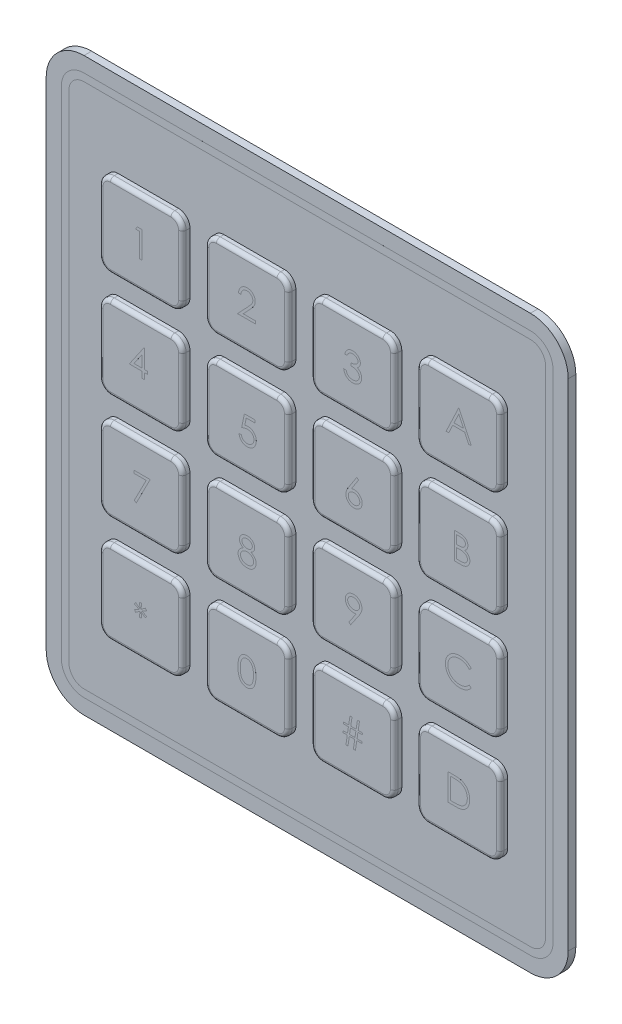
from build123d import *

# Parameters (mm, degrees)
SALIENTE_EXTRUIR1_DEPTH = 1
SALIENTE_EXTRUIR2_DEPTH = 1
REDONDEO2_R             = 0.5
SALIENTE_EXTRUIR3_DEPTH = 0.0001
SALIENTE_EXTRUIR4_DEPTH = 0.0001
CROQUIS5_W              = 21.5
CROQUIS5_H              = 1
SALIENTE_EXTRUIR5_DEPTH = 1


with BuildPart() as part:
    # Croquis1 → Saliente-Extruir1 (new body)
    with BuildSketch(Plane.XY):
        with BuildLine():
            Line((-29.5, -37.75), (29.5, -37.75))
            ThreePointArc((29.5, -37.75), (33.035533906, -36.285533906), (34.5, -32.75))
            Line((34.5, -32.75), (34.5, 32.75))
            ThreePointArc((34.5, 32.75), (33.035533906, 36.285533906), (29.5, 37.75))
            Line((29.5, 37.75), (-29.5, 37.75))
            ThreePointArc((-29.5, 37.75), (-33.035533906, 36.285533906), (-34.5, 32.75))
            Line((-34.5, 32.75), (-34.5, -32.75))
            ThreePointArc((-34.5, -32.75), (-33.035533906, -36.285533906), (-29.5, -37.75))
        make_face()
    extrude(amount=SALIENTE_EXTRUIR1_DEPTH)

    # Croquis2 → Saliente-Extruir2 (add)
    with BuildSketch(Plane.XY.offset(1)):
        with BuildLine():
            Line((-25, 15.5), (-17, 15.5))
            ThreePointArc((-17, 15.5), (-15.939339828, 15.939339828), (-15.5, 17))
            Line((-15.5, 17), (-15.5, 25))
            ThreePointArc((-15.5, 25), (-15.939339828, 26.060660172), (-17, 26.5))
            Line((-17, 26.5), (-25, 26.5))
            ThreePointArc((-25, 26.5), (-26.060660172, 26.060660172), (-26.5, 25))
            Line((-26.5, 25), (-26.5, 17))
            ThreePointArc((-26.5, 17), (-26.060660172, 15.939339828), (-25, 15.5))
        make_face()
        with BuildLine():
            Line((-3, 15.5), (-11, 15.5))
            ThreePointArc((-11, 15.5), (-12.060660172, 15.939339828), (-12.5, 17))
            Line((-12.5, 17), (-12.5, 25))
            ThreePointArc((-12.5, 25), (-12.060660172, 26.060660172), (-11, 26.5))
            Line((-11, 26.5), (-3, 26.5))
            ThreePointArc((-3, 26.5), (-1.939339828, 26.060660172), (-1.5, 25))
            Line((-1.5, 25), (-1.5, 17))
            ThreePointArc((-1.5, 17), (-1.939339828, 15.939339828), (-3, 15.5))
        make_face()
        with BuildLine():
            Line((-12.5, 11), (-12.5, 3))
            ThreePointArc((-12.5, 3), (-12.060660172, 1.939339828), (-11, 1.5))
            Line((-11, 1.5), (-3, 1.5))
            ThreePointArc((-3, 1.5), (-1.939339828, 1.939339828), (-1.5, 3))
            Line((-1.5, 3), (-1.5, 11))
            ThreePointArc((-1.5, 11), (-1.939339828, 12.060660172), (-3, 12.5))
            Line((-3, 12.5), (-11, 12.5))
            ThreePointArc((-11, 12.5), (-12.060660172, 12.060660172), (-12.5, 11))
        make_face()
        with BuildLine():
            Line((-25, 12.5), (-17, 12.5))
            ThreePointArc((-17, 12.5), (-15.939339828, 12.060660172), (-15.5, 11))
            Line((-15.5, 11), (-15.5, 3))
            ThreePointArc((-15.5, 3), (-15.939339828, 1.939339828), (-17, 1.5))
            Line((-17, 1.5), (-25, 1.5))
            ThreePointArc((-25, 1.5), (-26.060660172, 1.939339828), (-26.5, 3))
            Line((-26.5, 3), (-26.5, 11))
            ThreePointArc((-26.5, 11), (-26.060660172, 12.060660172), (-25, 12.5))
        make_face()
        with BuildLine():
            Line((25, 1.5), (17, 1.5))
            ThreePointArc((17, 1.5), (15.939339828, 1.939339828), (15.5, 3))
            Line((15.5, 3), (15.5, 11))
            ThreePointArc((15.5, 11), (15.939339828, 12.060660172), (17, 12.5))
            Line((17, 12.5), (25, 12.5))
            ThreePointArc((25, 12.5), (26.060660172, 12.060660172), (26.5, 11))
            Line((26.5, 11), (26.5, 3))
            ThreePointArc((26.5, 3), (26.060660172, 1.939339828), (25, 1.5))
        make_face()
        with BuildLine():
            Line((3, 12.5), (11, 12.5))
            ThreePointArc((11, 12.5), (12.060660172, 12.060660172), (12.5, 11))
            Line((12.5, 11), (12.5, 3))
            ThreePointArc((12.5, 3), (12.060660172, 1.939339828), (11, 1.5))
            Line((11, 1.5), (3, 1.5))
            ThreePointArc((3, 1.5), (1.939339828, 1.939339828), (1.5, 3))
            Line((1.5, 3), (1.5, 11))
            ThreePointArc((1.5, 11), (1.939339828, 12.060660172), (3, 12.5))
        make_face()
        with BuildLine():
            Line((1.5, 17), (1.5, 25))
            ThreePointArc((1.5, 25), (1.939339828, 26.060660172), (3, 26.5))
            Line((3, 26.5), (11, 26.5))
            ThreePointArc((11, 26.5), (12.060660172, 26.060660172), (12.5, 25))
            Line((12.5, 25), (12.5, 17))
            ThreePointArc((12.5, 17), (12.060660172, 15.939339828), (11, 15.5))
            Line((11, 15.5), (3, 15.5))
            ThreePointArc((3, 15.5), (1.939339828, 15.939339828), (1.5, 17))
        make_face()
        with BuildLine():
            Line((15.5, 17), (15.5, 25))
            ThreePointArc((15.5, 25), (15.939339828, 26.060660172), (17, 26.5))
            Line((17, 26.5), (25, 26.5))
            ThreePointArc((25, 26.5), (26.060660172, 26.060660172), (26.5, 25))
            Line((26.5, 25), (26.5, 17))
            ThreePointArc((26.5, 17), (26.060660172, 15.939339828), (25, 15.5))
            Line((25, 15.5), (17, 15.5))
            ThreePointArc((17, 15.5), (15.939339828, 15.939339828), (15.5, 17))
        make_face()
        with BuildLine():
            Line((25, -15.5), (17, -15.5))
            ThreePointArc((17, -15.5), (15.939339828, -15.939339828), (15.5, -17))
            Line((15.5, -17), (15.5, -25))
            ThreePointArc((15.5, -25), (15.939339828, -26.060660172), (17, -26.5))
            Line((17, -26.5), (25, -26.5))
            ThreePointArc((25, -26.5), (26.060660172, -26.060660172), (26.5, -25))
            Line((26.5, -25), (26.5, -17))
            ThreePointArc((26.5, -17), (26.060660172, -15.939339828), (25, -15.5))
        make_face()
        with BuildLine():
            Line((3, -15.5), (11, -15.5))
            ThreePointArc((11, -15.5), (12.060660172, -15.939339828), (12.5, -17))
            Line((12.5, -17), (12.5, -25))
            ThreePointArc((12.5, -25), (12.060660172, -26.060660172), (11, -26.5))
            Line((11, -26.5), (3, -26.5))
            ThreePointArc((3, -26.5), (1.939339828, -26.060660172), (1.5, -25))
            Line((1.5, -25), (1.5, -17))
            ThreePointArc((1.5, -17), (1.939339828, -15.939339828), (3, -15.5))
        make_face()
        with BuildLine():
            Line((12.5, -11), (12.5, -3))
            ThreePointArc((12.5, -3), (12.060660172, -1.939339828), (11, -1.5))
            Line((11, -1.5), (3, -1.5))
            ThreePointArc((3, -1.5), (1.939339828, -1.939339828), (1.5, -3))
            Line((1.5, -3), (1.5, -11))
            ThreePointArc((1.5, -11), (1.939339828, -12.060660172), (3, -12.5))
            Line((3, -12.5), (11, -12.5))
            ThreePointArc((11, -12.5), (12.060660172, -12.060660172), (12.5, -11))
        make_face()
        with BuildLine():
            Line((25, -12.5), (17, -12.5))
            ThreePointArc((17, -12.5), (15.939339828, -12.060660172), (15.5, -11))
            Line((15.5, -11), (15.5, -3))
            ThreePointArc((15.5, -3), (15.939339828, -1.939339828), (17, -1.5))
            Line((17, -1.5), (25, -1.5))
            ThreePointArc((25, -1.5), (26.060660172, -1.939339828), (26.5, -3))
            Line((26.5, -3), (26.5, -11))
            ThreePointArc((26.5, -11), (26.060660172, -12.060660172), (25, -12.5))
        make_face()
        with BuildLine():
            Line((-25, -1.5), (-17, -1.5))
            ThreePointArc((-17, -1.5), (-15.939339828, -1.939339828), (-15.5, -3))
            Line((-15.5, -3), (-15.5, -11))
            ThreePointArc((-15.5, -11), (-15.939339828, -12.060660172), (-17, -12.5))
            Line((-17, -12.5), (-25, -12.5))
            ThreePointArc((-25, -12.5), (-26.060660172, -12.060660172), (-26.5, -11))
            Line((-26.5, -11), (-26.5, -3))
            ThreePointArc((-26.5, -3), (-26.060660172, -1.939339828), (-25, -1.5))
        make_face()
        with BuildLine():
            Line((-3, -12.5), (-11, -12.5))
            ThreePointArc((-11, -12.5), (-12.060660172, -12.060660172), (-12.5, -11))
            Line((-12.5, -11), (-12.5, -3))
            ThreePointArc((-12.5, -3), (-12.060660172, -1.939339828), (-11, -1.5))
            Line((-11, -1.5), (-3, -1.5))
            ThreePointArc((-3, -1.5), (-1.939339828, -1.939339828), (-1.5, -3))
            Line((-1.5, -3), (-1.5, -11))
            ThreePointArc((-1.5, -11), (-1.939339828, -12.060660172), (-3, -12.5))
        make_face()
        with BuildLine():
            Line((-1.5, -17), (-1.5, -25))
            ThreePointArc((-1.5, -25), (-1.939339828, -26.060660172), (-3, -26.5))
            Line((-3, -26.5), (-11, -26.5))
            ThreePointArc((-11, -26.5), (-12.060660172, -26.060660172), (-12.5, -25))
            Line((-12.5, -25), (-12.5, -17))
            ThreePointArc((-12.5, -17), (-12.060660172, -15.939339828), (-11, -15.5))
            Line((-11, -15.5), (-3, -15.5))
            ThreePointArc((-3, -15.5), (-1.939339828, -15.939339828), (-1.5, -17))
        make_face()
        with BuildLine():
            Line((-15.5, -17), (-15.5, -25))
            ThreePointArc((-15.5, -25), (-15.939339828, -26.060660172), (-17, -26.5))
            Line((-17, -26.5), (-25, -26.5))
            ThreePointArc((-25, -26.5), (-26.060660172, -26.060660172), (-26.5, -25))
            Line((-26.5, -25), (-26.5, -17))
            ThreePointArc((-26.5, -17), (-26.060660172, -15.939339828), (-25, -15.5))
            Line((-25, -15.5), (-17, -15.5))
            ThreePointArc((-17, -15.5), (-15.939339828, -15.939339828), (-15.5, -17))
        make_face()
    extrude(amount=SALIENTE_EXTRUIR2_DEPTH)

    # Redondeo2
    redondeo2_edges = [part.edges().sort_by_distance(p)[0] for p in [
        (-21, -26.5, 2),
        (-26.060660172, -26.060660172, 2),
        (-26.5, -21, 2),
        (-26.060660172, -15.939339828, 2),
        (-21, -15.5, 2),
        (-15.939339828, -15.939339828, 2),
        (-15.5, -21, 2),
        (-15.939339828, -26.060660172, 2),
        (-7, -26.5, 2),
        (-12.060660172, -26.060660172, 2),
        (-12.5, -21, 2),
        (-12.060660172, -15.939339828, 2),
        (-7, -15.5, 2),
        (-1.939339828, -15.939339828, 2),
        (-1.5, -21, 2),
        (-1.939339828, -26.060660172, 2),
        (7, -15.5, 2),
        (12.060660172, -15.939339828, 2),
        (12.5, -21, 2),
        (12.060660172, -26.060660172, 2),
        (7, -26.5, 2),
        (1.939339828, -26.060660172, 2),
        (1.5, -21, 2),
        (1.939339828, -15.939339828, 2),
        (21, -15.5, 2),
        (26.060660172, -15.939339828, 2),
        (26.5, -21, 2),
        (26.060660172, -26.060660172, 2),
        (21, -26.5, 2),
        (15.939339828, -26.060660172, 2),
        (15.5, -21, 2),
        (15.939339828, -15.939339828, 2),
        (21, -12.5, 2),
        (15.939339828, -12.060660172, 2),
        (15.5, -7, 2),
        (15.939339828, -1.939339828, 2),
        (21, -1.5, 2),
        (26.060660172, -1.939339828, 2),
        (26.5, -7, 2),
        (26.060660172, -12.060660172, 2),
        (12.5, -7, 2),
        (12.060660172, -12.060660172, 2),
        (7, -12.5, 2),
        (1.939339828, -12.060660172, 2),
        (1.5, -7, 2),
        (1.939339828, -1.939339828, 2),
        (7, -1.5, 2),
        (12.060660172, -1.939339828, 2),
        (-12.5, -7, 2),
        (-12.060660172, -1.939339828, 2),
        (-7, -1.5, 2),
        (-1.939339828, -1.939339828, 2),
        (-1.5, -7, 2),
        (-1.939339828, -12.060660172, 2),
        (-7, -12.5, 2),
        (-12.060660172, -12.060660172, 2),
        (-21, -1.5, 2),
        (-15.939339828, -1.939339828, 2),
        (-15.5, -7, 2),
        (-15.939339828, -12.060660172, 2),
        (-21, -12.5, 2),
        (-26.060660172, -12.060660172, 2),
        (-26.5, -7, 2),
        (-26.060660172, -1.939339828, 2),
        (-21, 12.5, 2),
        (-15.939339828, 12.060660172, 2),
        (-15.5, 7, 2),
        (-15.939339828, 1.939339828, 2),
        (-21, 1.5, 2),
        (-26.060660172, 1.939339828, 2),
        (-26.5, 7, 2),
        (-26.060660172, 12.060660172, 2),
        (-7, 12.5, 2),
        (-1.939339828, 12.060660172, 2),
        (-1.5, 7, 2),
        (-1.939339828, 1.939339828, 2),
        (-7, 1.5, 2),
        (-12.060660172, 1.939339828, 2),
        (-12.5, 7, 2),
        (-12.060660172, 12.060660172, 2),
        (12.5, 7, 2),
        (12.060660172, 1.939339828, 2),
        (7, 1.5, 2),
        (1.939339828, 1.939339828, 2),
        (1.5, 7, 2),
        (1.939339828, 12.060660172, 2),
        (7, 12.5, 2),
        (12.060660172, 12.060660172, 2),
        (21, 1.5, 2),
        (15.939339828, 1.939339828, 2),
        (15.5, 7, 2),
        (15.939339828, 12.060660172, 2),
        (21, 12.5, 2),
        (26.060660172, 12.060660172, 2),
        (26.5, 7, 2),
        (26.060660172, 1.939339828, 2),
        (21, 26.5, 2),
        (26.060660172, 26.060660172, 2),
        (26.5, 21, 2),
        (26.060660172, 15.939339828, 2),
        (21, 15.5, 2),
        (15.939339828, 15.939339828, 2),
        (15.5, 21, 2),
        (15.939339828, 26.060660172, 2),
        (7, 26.5, 2),
        (12.060660172, 26.060660172, 2),
        (12.5, 21, 2),
        (12.060660172, 15.939339828, 2),
        (7, 15.5, 2),
        (1.939339828, 15.939339828, 2),
        (1.5, 21, 2),
        (1.939339828, 26.060660172, 2),
        (-7, 15.5, 2),
        (-12.060660172, 15.939339828, 2),
        (-12.5, 21, 2),
        (-12.060660172, 26.060660172, 2),
        (-7, 26.5, 2),
        (-1.939339828, 26.060660172, 2),
        (-1.5, 21, 2),
        (-1.939339828, 15.939339828, 2),
        (-21, 15.5, 2),
        (-26.060660172, 15.939339828, 2),
        (-26.5, 21, 2),
        (-26.060660172, 26.060660172, 2),
        (-21, 26.5, 2),
        (-15.939339828, 26.060660172, 2),
        (-15.5, 21, 2),
        (-15.939339828, 15.939339828, 2),
    ]]
    fillet(redondeo2_edges, radius=REDONDEO2_R)

    # Croquis3 → Saliente-Extruir3 (add)
    with BuildSketch(Plane.XY.offset(1)):
        with BuildLine():
            Line((-32.5, 32.75), (-32.5, -32.75))
            ThreePointArc((-32.5, -32.75), (-31.621320344, -34.871320344), (-29.5, -35.75))
            Line((-29.5, -35.75), (29.5, -35.75))
            ThreePointArc((29.5, -35.75), (31.621320344, -34.871320344), (32.5, -32.75))
            Line((32.5, -32.75), (32.5, 32.75))
            ThreePointArc((32.5, 32.75), (31.621320344, 34.871320344), (29.5, 35.75))
            Line((29.5, 35.75), (-29.5, 35.75))
            ThreePointArc((-29.5, 35.75), (-31.621320344, 34.871320344), (-32.5, 32.75))
        make_face()
        with BuildLine():
            Line((29.5, 34.75), (-29.5, 34.75))
            ThreePointArc((-29.5, 34.75), (-30.914213562, 34.164213562), (-31.5, 32.75))
            Line((-31.5, 32.75), (-31.5, -32.75))
            ThreePointArc((-31.5, -32.75), (-30.914213562, -34.164213562), (-29.5, -34.75))
            Line((-29.5, -34.75), (29.5, -34.75))
            ThreePointArc((29.5, -34.75), (30.914213562, -34.164213562), (31.5, -32.75))
            Line((31.5, -32.75), (31.5, 32.75))
            ThreePointArc((31.5, 32.75), (30.914213562, 34.164213562), (29.5, 34.75))
        make_face(mode=Mode.SUBTRACT)
    extrude(amount=SALIENTE_EXTRUIR3_DEPTH)

    # Croquis4 → Saliente-Extruir4 (add)
    # profile 1 of 16: a face of its own
    with BuildSketch(Plane.XY.offset(2)):
        Polygon((-21.475903314, 22.653601571), (-20.828767897, 22.653601571), (-20.828767897, 19.153601571), (-21.142870461, 19.153601571), (-21.142870461, 22.294627212), (-21.681332, 22.294627212), align=None)
    # profile 2 of 16: a face of its own
    with BuildSketch(Plane.XY.offset(2)):
        with BuildLine():
            Line((-7.760426646, 21.774023828), (-8.074529211, 21.774023828))
            add(Edge.make_bspline(
                [(-8.074529211, 21.774023828), (-8.072482058, 21.815694715), (-8.068461504, 21.89753523), (-8.049633214, 22.016859136), (-8.022692337, 22.130913935), (-7.984600883, 22.238783849), (-7.937294605, 22.341422656), (-7.880564578, 22.438422672), (-7.813370727, 22.529413861), (-7.737163993, 22.613552704), (-7.654395354, 22.690740275), (-7.565089415, 22.757395518), (-7.471244388, 22.813713189), (-7.373144989, 22.860794431), (-7.269684425, 22.896134277), (-7.161801567, 22.922355916), (-7.049022431, 22.938132262), (-6.972182409, 22.939828048), (-6.933102929, 22.940690494)],
                knots=[0, 0, 0, 0, 1.10065271, 2.161652631, 3.183658789, 4.190468796, 5.17591951, 6.163126047, 7.15150782, 8.156236427, 9.156009102, 10.134482811, 11.092018607, 12.041330605, 13.001268258, 13.972401359, 14.968799086, 16, 16, 16, 16], degree=3))
            add(Edge.make_bspline(
                [(-6.933102929, 22.940690494), (-6.894724854, 22.939792038), (-6.81931331, 22.938026603), (-6.709251295, 22.922865574), (-6.604474001, 22.899119982), (-6.505186234, 22.865804566), (-6.41218017, 22.821020138), (-6.324757125, 22.7672226), (-6.241876314, 22.705002768), (-6.167269531, 22.631748955), (-6.098761452, 22.55354657), (-6.039659196, 22.470058667), (-5.989046033, 22.383829381), (-5.946858353, 22.294201179), (-5.915802214, 22.200330151), (-5.892224006, 22.103582948), (-5.878896592, 22.002958137), (-5.876851169, 21.934851582), (-5.875811262, 21.900225751)],
                knots=[0, 0, 0, 0, 1.111607364, 2.184268762, 3.212621178, 4.221274766, 5.211760367, 6.196651075, 7.1921475, 8.207485113, 9.220403448, 10.201281604, 11.166441695, 12.114753415, 13.065576456, 14.026450734, 14.996634279, 16, 16, 16, 16], degree=3))
            add(Edge.make_bspline(
                [(-5.875811262, 21.900225751), (-5.877504525, 21.851477916), (-5.880861336, 21.754837702), (-5.909575713, 21.61282284), (-5.954422224, 21.475229421), (-6.008419581, 21.364492118), (-6.062892025, 21.275258625), (-6.111979532, 21.20178992), (-6.169444343, 21.122684451), (-6.236122841, 21.038207114), (-6.310635713, 20.947696209), (-6.393657877, 20.851206414), (-6.485781359, 20.749734644), (-6.550439859, 20.680429042), (-6.583944275, 20.644516616)],
                knots=[0, 0, 0, 0, 1.184426356, 2.348067706, 3.509069118, 4.696110526, 5.333549288, 6.050745305, 6.844228056, 7.710549037, 8.667450064, 9.695053472, 10.805634456, 12, 12, 12, 12], degree=3))
            Line((-6.583944275, 20.644516616), (-7.459645396, 19.709921263))
            Line((-7.459645396, 19.709921263), (-5.830939467, 19.709921263))
            Line((-5.830939467, 19.709921263), (-5.830939467, 19.350946904))
            Line((-5.830939467, 19.350946904), (-8.209144595, 19.350946904))
            Line((-8.209144595, 19.350946904), (-6.8517728, 20.799464533))
            add(Edge.make_bspline(
                [(-6.8517728, 20.799464533), (-6.818724913, 20.833962839), (-6.755246686, 20.900227026), (-6.66546411, 20.996969986), (-6.584825121, 21.086719527), (-6.512807728, 21.169306075), (-6.450974223, 21.245937643), (-6.396101991, 21.314132347), (-6.3521364, 21.376886797), (-6.304421004, 21.449627411), (-6.258207023, 21.538439728), (-6.218494667, 21.646973417), (-6.194279819, 21.75870067), (-6.191374983, 21.834202707), (-6.189913826, 21.872180879)],
                knots=[0, 0, 0, 0, 1.329631726, 2.553950428, 3.673215718, 4.687767853, 5.603093632, 6.413772471, 7.123043292, 7.734684054, 8.834405432, 9.900288307, 10.943827018, 12, 12, 12, 12], degree=3))
            add(Edge.make_bspline(
                [(-6.189913826, 21.872180879), (-6.190549568, 21.896062277), (-6.191802494, 21.943127928), (-6.202860192, 22.012133687), (-6.219570698, 22.0786985), (-6.243515956, 22.14302712), (-6.275122696, 22.204472772), (-6.313596076, 22.263110252), (-6.357986139, 22.319799217), (-6.409337409, 22.372952515), (-6.465748928, 22.421633721), (-6.525343178, 22.464757806), (-6.588393282, 22.500796917), (-6.654633404, 22.530340414), (-6.723878874, 22.553515795), (-6.796263619, 22.569574375), (-6.871587635, 22.579656859), (-6.923021131, 22.58102103), (-6.94922873, 22.581716135)],
                knots=[0, 0, 0, 0, 0.991446411, 1.95395049, 2.89581595, 3.838931463, 4.798493298, 5.75982156, 6.748411868, 7.785213223, 8.824556874, 9.840280684, 10.836137867, 11.835679398, 12.848801643, 13.863922112, 14.911575587, 16, 16, 16, 16], degree=3))
            add(Edge.make_bspline(
                [(-6.94922873, 22.581716135), (-6.976599563, 22.581001103), (-7.030351359, 22.579596898), (-7.109270392, 22.569774234), (-7.184556169, 22.552828393), (-7.256398072, 22.529651719), (-7.324917658, 22.50019317), (-7.389781702, 22.463501425), (-7.450844591, 22.419717932), (-7.508221115, 22.370077376), (-7.561085094, 22.314809775), (-7.60753197, 22.253199812), (-7.648115984, 22.186372396), (-7.683525217, 22.114507846), (-7.712280907, 22.036954066), (-7.734254058, 21.953986361), (-7.751640904, 21.865964979), (-7.757449425, 21.805179895), (-7.760426646, 21.774023828)],
                knots=[0, 0, 0, 0, 1.031018746, 2.02475058, 2.990194455, 3.934040569, 4.864654155, 5.795059489, 6.735614925, 7.690564532, 8.649604399, 9.611025574, 10.590972636, 11.591080095, 12.624614302, 13.701020113, 14.821632451, 16, 16, 16, 16], degree=3))
        make_face()
    # profile 3 of 16: a face of its own
    with BuildSketch(Plane.XY.offset(2)):
        with BuildLine():
            Line((6.271796087, 21.815069713), (5.957693523, 21.815069713))
            add(Edge.make_bspline(
                [(5.957693523, 21.815069713), (5.966203074, 21.850302197), (5.98283855, 21.919178822), (6.017536123, 22.017586082), (6.055335378, 22.110709604), (6.100724483, 22.196805677), (6.150233237, 22.27760458), (6.206955958, 22.351273705), (6.268275681, 22.41968667), (6.33610063, 22.480399908), (6.407229292, 22.535377637), (6.482663912, 22.582252694), (6.560886805, 22.622576847), (6.642439938, 22.655797079), (6.72756611, 22.680822603), (6.815495733, 22.698979408), (6.906459234, 22.710770522), (6.968206824, 22.711921286), (6.99956051, 22.712505611)],
                knots=[0, 0, 0, 0, 1.162005537, 2.271625781, 3.343758855, 4.383309926, 5.390229558, 6.379919256, 7.361854164, 8.333198761, 9.295911338, 10.242430842, 11.177959212, 12.116337295, 13.062827104, 14.020064771, 14.994644689, 16, 16, 16, 16], degree=3))
            add(Edge.make_bspline(
                [(6.99956051, 22.712505611), (7.045243253, 22.71112638), (7.135612263, 22.708398005), (7.26837531, 22.683483568), (7.39640213, 22.644058436), (7.518291377, 22.589584709), (7.63150981, 22.522397396), (7.732245997, 22.442432659), (7.819134507, 22.351233357), (7.892028885, 22.250500793), (7.949103884, 22.142845284), (7.991190258, 22.032045126), (8.016811939, 21.918363155), (8.020132495, 21.841605876), (8.021796087, 21.803150643)],
                knots=[0, 0, 0, 0, 1.083050992, 2.142477498, 3.193116406, 4.255571735, 5.30263384, 6.308962982, 7.297363603, 8.282367274, 9.249857812, 10.179914175, 11.08814088, 12, 12, 12, 12], degree=3))
            add(Edge.make_bspline(
                [(8.021796087, 21.803150643), (8.020632496, 21.766143848), (8.018355529, 21.693727293), (7.999021824, 21.588005796), (7.966485561, 21.488364196), (7.921415798, 21.394383034), (7.863074248, 21.306658194), (7.792401551, 21.224992303), (7.708898889, 21.149023145), (7.645619951, 21.105503672), (7.613042081, 21.083098559)],
                knots=[0, 0, 0, 0, 1.024540389, 2.004866551, 2.965041327, 3.920577974, 4.882998113, 5.874504559, 6.905732034, 8, 8, 8, 8], degree=3))
            add(Edge.make_bspline(
                [(7.613042081, 21.083098559), (7.650273836, 21.065120388), (7.72404071, 21.02950043), (7.824591239, 20.959644673), (7.915869115, 20.878988325), (7.966772834, 20.816045672), (7.992348972, 20.784420675)],
                knots=[0, 0, 0, 0, 1.015518401, 2.012035669, 3.001164323, 4, 4, 4, 4], degree=3))
            add(Edge.make_bspline(
                [(7.992348972, 20.784420675), (8.009190314, 20.761362923), (8.04259721, 20.715625007), (8.083832744, 20.642088581), (8.121241858, 20.567737091), (8.150392078, 20.490577685), (8.172965945, 20.411504672), (8.189101977, 20.330382276), (8.199126118, 20.247144253), (8.20056167, 20.190831773), (8.201283267, 20.162525643)],
                knots=[0, 0, 0, 0, 1.025084078, 2.033381695, 3.024893161, 4.013698104, 4.991890475, 5.976764909, 6.982997093, 8, 8, 8, 8], degree=3))
            add(Edge.make_bspline(
                [(8.201283267, 20.162525643), (8.199488753, 20.113515921), (8.195908171, 20.01572712), (8.163904097, 19.871252398), (8.114290856, 19.730026896), (8.04383392, 19.594952056), (7.957966412, 19.468571675), (7.855809087, 19.355495366), (7.738522679, 19.258296762), (7.60771703, 19.177086534), (7.465999902, 19.112168612), (7.31442431, 19.067111169), (7.155174256, 19.037765169), (7.045966958, 19.0346183), (6.990445927, 19.033018431)],
                knots=[0, 0, 0, 0, 0.955779014, 1.907060117, 2.875433937, 3.871313158, 4.872415639, 5.851225146, 6.836215519, 7.83643374, 8.849228613, 9.86973379, 10.916971861, 12, 12, 12, 12], degree=3))
            add(Edge.make_bspline(
                [(6.990445927, 19.033018431), (6.953026627, 19.033886644), (6.879397922, 19.035594999), (6.771154423, 19.0472736), (6.667832724, 19.068603605), (6.569293126, 19.09730691), (6.47544809, 19.133698652), (6.386583985, 19.17901735), (6.302154091, 19.232328852), (6.22295514, 19.29426244), (6.148996572, 19.36354378), (6.082243848, 19.44140279), (6.021584055, 19.526400194), (5.968641416, 19.61952325), (5.921004464, 19.719568507), (5.881823507, 19.827817006), (5.847337938, 19.943301028), (5.831304474, 20.023778768), (5.823078139, 20.065069713)],
                knots=[0, 0, 0, 0, 1.048658725, 2.063410685, 3.046034179, 4.001477787, 4.936774919, 5.862367409, 6.792675028, 7.730719943, 8.675894397, 9.627829632, 10.600096036, 11.597688215, 12.626045268, 13.701542398, 14.82072376, 16, 16, 16, 16], degree=3))
            Line((5.823078139, 20.065069713), (6.137180703, 20.065069713))
            add(Edge.make_bspline(
                [(6.137180703, 20.065069713), (6.145363994, 20.0381207), (6.161281207, 19.985702528), (6.188375505, 19.910262223), (6.219243777, 19.841104169), (6.252358336, 19.777721047), (6.287136782, 19.719488645), (6.326051707, 19.667946776), (6.366220852, 19.620831574), (6.396500205, 19.594286962), (6.411319325, 19.581295675)],
                knots=[0, 0, 0, 0, 1.198163088, 2.33053128, 3.407730985, 4.417276592, 5.372219308, 6.28897303, 7.162600585, 8, 8, 8, 8], degree=3))
            add(Edge.make_bspline(
                [(6.411319325, 19.581295675), (6.430915901, 19.566187341), (6.470048564, 19.536017309), (6.533816795, 19.49751568), (6.600881681, 19.464154655), (6.672696355, 19.438670959), (6.747711126, 19.417093299), (6.827138491, 19.40297278), (6.910277708, 19.393284608), (6.967045472, 19.392429677), (6.996054901, 19.39199279)],
                knots=[0, 0, 0, 0, 0.946170439, 1.889420265, 2.845303464, 3.807233317, 4.801018734, 5.828864929, 6.890507805, 8, 8, 8, 8], degree=3))
            add(Edge.make_bspline(
                [(6.996054901, 19.39199279), (7.028808404, 19.392608695), (7.092855051, 19.393813045), (7.18630991, 19.404888752), (7.275217358, 19.421019165), (7.358590284, 19.445932148), (7.437520791, 19.476712999), (7.510902441, 19.515361405), (7.579698547, 19.560706127), (7.643027952, 19.612245285), (7.69997346, 19.66866678), (7.750112973, 19.727679851), (7.792737635, 19.789035681), (7.827121213, 19.853073802), (7.854271763, 19.919529031), (7.872754964, 19.98858786), (7.885606479, 20.059685126), (7.886653091, 20.108014095), (7.887180703, 20.132377405)],
                knots=[0, 0, 0, 0, 1.217147791, 2.380027433, 3.494444702, 4.572153297, 5.609568379, 6.639424714, 7.649109417, 8.668170816, 9.669597737, 10.625200337, 11.543417969, 12.441394052, 13.322311151, 14.205496177, 15.095365482, 16, 16, 16, 16], degree=3))
            add(Edge.make_bspline(
                [(7.887180703, 20.132377405), (7.885650401, 20.164988744), (7.882597413, 20.230049153), (7.859288833, 20.325766727), (7.820949969, 20.417990139), (7.767277458, 20.505145929), (7.701941729, 20.585921831), (7.625576822, 20.657993313), (7.537548594, 20.717463404), (7.456528725, 20.758552061), (7.384763568, 20.786589136), (7.323348184, 20.8052641), (7.254591581, 20.821077756), (7.179325232, 20.835790028), (7.096982015, 20.848311376), (7.007651577, 20.858753192), (6.911315816, 20.867108233), (6.84462465, 20.870839328), (6.810257626, 20.872762021)],
                knots=[0, 0, 0, 0, 1.07054697, 2.135767047, 3.216561865, 4.33974944, 5.486079747, 6.621378074, 7.775625952, 8.963672916, 9.598146892, 10.304877434, 11.070270905, 11.915000392, 12.823868403, 13.805723172, 14.86925407, 16, 16, 16, 16], degree=3))
            Line((6.810257626, 20.872762021), (6.810257626, 21.23173638))
            add(Edge.make_bspline(
                [(6.810257626, 21.23173638), (6.853558792, 21.232471184), (6.938375138, 21.233910484), (7.062269443, 21.251318494), (7.180742755, 21.275399122), (7.291169497, 21.312284314), (7.39181821, 21.355124611), (7.479137812, 21.404976821), (7.55190496, 21.46039157), (7.609766031, 21.522224179), (7.65329526, 21.588539227), (7.685122057, 21.657655884), (7.703922384, 21.730179945), (7.70643205, 21.779674613), (7.707693523, 21.804552886)],
                knots=[0, 0, 0, 0, 1.321986639, 2.589447074, 3.816329219, 5.01088745, 6.139805852, 7.153945165, 8.075214402, 8.924034688, 9.728124013, 10.488707548, 11.240355623, 12, 12, 12, 12], degree=3))
            add(Edge.make_bspline(
                [(7.707693523, 21.804552886), (7.707279112, 21.822830631), (7.706454661, 21.859193338), (7.696057384, 21.912318407), (7.680433343, 21.963819353), (7.658953613, 22.013477163), (7.630203415, 22.060947437), (7.595797428, 22.106634886), (7.554829328, 22.150278665), (7.507883881, 22.190958985), (7.457472076, 22.229728222), (7.402222301, 22.262641859), (7.343800426, 22.290786921), (7.282141771, 22.313996423), (7.217046241, 22.331455711), (7.148819683, 22.343991553), (7.077332, 22.351829207), (7.028560268, 22.352957623), (7.003767241, 22.353531252)],
                knots=[0, 0, 0, 0, 0.884392785, 1.759457502, 2.611959086, 3.489218968, 4.37281399, 5.2945488, 6.255912374, 7.266815255, 8.301784654, 9.332968512, 10.37626691, 11.440494194, 12.520033166, 13.637162961, 14.798855837, 16, 16, 16, 16], degree=3))
            add(Edge.make_bspline(
                [(7.003767241, 22.353531252), (6.963915573, 22.35213989), (6.886075997, 22.349422236), (6.77386108, 22.325619223), (6.669541746, 22.287641139), (6.589803079, 22.24230812), (6.530920505, 22.197557686), (6.488843567, 22.158475299), (6.447523057, 22.115042476), (6.40967738, 22.0645841), (6.371403403, 22.01051731), (6.336558842, 21.950093629), (6.302699149, 21.884889234), (6.2822966, 21.8387936), (6.271796087, 21.815069713)],
                knots=[0, 0, 0, 0, 1.472543308, 2.876219568, 4.221790263, 5.565193594, 6.249813518, 6.953379497, 7.687249741, 8.463570142, 9.283606569, 10.136032583, 11.040678096, 12, 12, 12, 12], degree=3))
        make_face()
    # profile 4 of 16: a face of its own
    with BuildSketch(Plane.XY.offset(2)):
        Polygon((-20.602702639, 9.226320292), (-20.538900556, 9.226320292), (-20.538900556, 6.803243369), (-20.135054402, 6.803243369), (-20.135054402, 6.44426901), (-20.538900556, 6.44426901), (-20.538900556, 5.636576702), (-20.85300312, 5.636576702), (-20.85300312, 6.44426901), (-22.51325953, 6.44426901), align=None)
        Polygon((-20.85300312, 6.803243369), (-20.85300312, 8.32327542), (-21.896272351, 6.803243369), align=None, mode=Mode.SUBTRACT)
    # profile 5 of 16: a face of its own
    with BuildSketch(Plane.XY.offset(2)):
        with BuildLine():
            Line((-5.868440642, 8.341698601), (-5.868440642, 7.982724242))
            Line((-5.868440642, 7.982724242), (-7.058945449, 7.982724242))
            Line((-7.058945449, 7.982724242), (-7.247547212, 7.062151326))
            add(Edge.make_bspline(
                [(-7.247547212, 7.062151326), (-7.210491338, 7.072381597), (-7.138701442, 7.092201131), (-7.032741581, 7.114206901), (-6.932149378, 7.127472346), (-6.866874007, 7.129283656), (-6.835287597, 7.13016014)],
                knots=[0, 0, 0, 0, 1.100273476, 2.13160584, 3.095893838, 4, 4, 4, 4], degree=3))
            add(Edge.make_bspline(
                [(-6.835287597, 7.13016014), (-6.796203857, 7.129314204), (-6.71935546, 7.127650883), (-6.606916513, 7.111679034), (-6.49958362, 7.086539119), (-6.397581249, 7.051418597), (-6.300720699, 7.006508864), (-6.209893137, 6.950408924), (-6.123735224, 6.884875593), (-6.04379263, 6.809530581), (-5.971268322, 6.726608964), (-5.907502332, 6.637451093), (-5.853339742, 6.542923431), (-5.809778987, 6.442122822), (-5.774994653, 6.336163669), (-5.751842658, 6.223931086), (-5.736425949, 6.106482966), (-5.734703563, 6.026178396), (-5.733825257, 5.985228249)],
                knots=[0, 0, 0, 0, 1.052922333, 2.070308379, 3.05430497, 4.020497103, 4.973039431, 5.925935799, 6.892292201, 7.88610001, 8.88166317, 9.857072816, 10.836096531, 11.812156883, 12.81219415, 13.836441305, 14.89672472, 16, 16, 16, 16], degree=3))
            add(Edge.make_bspline(
                [(-5.733825257, 5.985228249), (-5.734490332, 5.956706028), (-5.735811495, 5.900047041), (-5.742530083, 5.81590284), (-5.755465799, 5.733540007), (-5.772833523, 5.652947615), (-5.795375941, 5.574278243), (-5.822664995, 5.497306715), (-5.856061022, 5.422512108), (-5.892692397, 5.349186713), (-5.933938875, 5.278988206), (-5.979717383, 5.21333922), (-6.028082874, 5.151254938), (-6.080124259, 5.093401205), (-6.136325255, 5.040158187), (-6.196005221, 4.991209906), (-6.25868794, 4.945728575), (-6.325343183, 4.90556038), (-6.394485666, 4.868597424), (-6.467113883, 4.838273887), (-6.541574583, 4.811163359), (-6.618939459, 4.789553831), (-6.699033272, 4.772621276), (-6.781988047, 4.761120676), (-6.867368717, 4.752744238), (-6.92524373, 4.752219881), (-6.954478302, 4.751955012)],
                knots=[0, 0, 0, 0, 1.056347294, 2.098418968, 3.122841568, 4.141288669, 5.149314143, 6.15115421, 7.162517403, 8.180376062, 9.185164535, 10.17417709, 11.141909838, 12.097768115, 13.052685741, 14.0056014, 14.954263652, 15.917497458, 16.885230207, 17.854509472, 18.828990115, 19.81800267, 20.826176721, 21.857883937, 22.917946725, 24, 24, 24, 24], degree=3))
            add(Edge.make_bspline(
                [(-6.954478302, 4.751955012), (-6.989352483, 4.75264585), (-7.057963313, 4.754004992), (-7.15848388, 4.768223477), (-7.255198486, 4.788587393), (-7.347328587, 4.819223663), (-7.435699851, 4.857610958), (-7.519122569, 4.906127129), (-7.599728345, 4.961106233), (-7.674240382, 5.025986586), (-7.743396495, 5.096902268), (-7.805303004, 5.173859909), (-7.860436581, 5.255589351), (-7.907914328, 5.342487505), (-7.948412349, 5.434326036), (-7.980227337, 5.531449037), (-8.005905692, 5.633349041), (-8.016769113, 5.703502552), (-8.022286796, 5.739134499)],
                knots=[0, 0, 0, 0, 1.0467383, 2.05933395, 3.04377827, 4.011590433, 4.970194871, 5.932262533, 6.905835911, 7.896367577, 8.894135286, 9.877477877, 10.858688626, 11.851381753, 12.8477658, 13.868841284, 14.917554742, 16, 16, 16, 16], degree=3))
            Line((-8.022286796, 5.739134499), (-7.708184231, 5.739134499))
            add(Edge.make_bspline(
                [(-7.708184231, 5.739134499), (-7.700455674, 5.705758046), (-7.685600958, 5.641606651), (-7.652995209, 5.55147531), (-7.613129333, 5.471156086), (-7.565724985, 5.399586503), (-7.509174954, 5.337177506), (-7.444645526, 5.281560444), (-7.372297802, 5.231385315), (-7.291904573, 5.189562547), (-7.207091493, 5.153893794), (-7.118324283, 5.130142099), (-7.028019937, 5.113441206), (-6.966941567, 5.111769445), (-6.936249135, 5.11092937)],
                knots=[0, 0, 0, 0, 1.136247022, 2.183929868, 3.172523383, 4.106158343, 5.02341133, 5.958108904, 6.928429099, 7.938127109, 8.96079061, 9.975095812, 10.982467395, 12, 12, 12, 12], degree=3))
            add(Edge.make_bspline(
                [(-6.936249135, 5.11092937), (-6.906290691, 5.111750148), (-6.847302269, 5.113366267), (-6.760490882, 5.125805279), (-6.676678008, 5.14496285), (-6.596690651, 5.173632705), (-6.519129111, 5.208477424), (-6.445955341, 5.253192499), (-6.375052464, 5.304652518), (-6.30862433, 5.363609148), (-6.247784881, 5.428578843), (-6.19402876, 5.498056236), (-6.149251847, 5.572173083), (-6.111517738, 5.649646235), (-6.082864439, 5.731324793), (-6.062423458, 5.816825968), (-6.050420399, 5.906360948), (-6.048769219, 5.967430258), (-6.047927821, 5.998549563)],
                knots=[0, 0, 0, 0, 1.027316725, 2.022795036, 3.002884548, 3.971462791, 4.93288096, 5.914575861, 6.907176829, 7.935150275, 8.956128384, 9.956726525, 10.942570165, 11.921478529, 12.907843606, 13.90538589, 14.932640048, 16, 16, 16, 16], degree=3))
            add(Edge.make_bspline(
                [(-6.047927821, 5.998549563), (-6.048586301, 6.026625314), (-6.04987518, 6.081579603), (-6.060405751, 6.16197881), (-6.078722723, 6.238051852), (-6.104146603, 6.310166086), (-6.136426111, 6.378389529), (-6.175872423, 6.442792589), (-6.223225821, 6.502526422), (-6.27731771, 6.557618976), (-6.336575751, 6.60846385), (-6.402019493, 6.651807937), (-6.47227942, 6.688271855), (-6.546509019, 6.719739853), (-6.626473918, 6.742340598), (-6.71059055, 6.759308484), (-6.799767258, 6.769123846), (-6.860737947, 6.770485735), (-6.892078462, 6.771185781)],
                knots=[0, 0, 0, 0, 1.045622112, 2.046656509, 3.013763289, 3.955457236, 4.890082067, 5.820317437, 6.762574623, 7.722996705, 8.69280354, 9.665887285, 10.63943826, 11.638615906, 12.663482002, 13.728887084, 14.832589034, 16, 16, 16, 16], degree=3))
            add(Edge.make_bspline(
                [(-6.892078462, 6.771185781), (-6.919207391, 6.77060519), (-6.975221746, 6.769406416), (-7.061144573, 6.760579919), (-7.151436296, 6.746340625), (-7.245750792, 6.726754377), (-7.3443713, 6.701123301), (-7.4470897, 6.6704088), (-7.554121967, 6.633686801), (-7.626239691, 6.605954588), (-7.663312437, 6.591698601)],
                knots=[0, 0, 0, 0, 0.817624296, 1.688186739, 2.600797293, 3.572016777, 4.590301741, 5.671205678, 6.80286297, 8, 8, 8, 8], degree=3))
            Line((-7.663312437, 6.591698601), (-7.304338078, 8.341698601))
            Line((-7.304338078, 8.341698601), (-5.868440642, 8.341698601))
        make_face()
    # profile 6 of 16: a face of its own
    with BuildSketch(Plane.XY.offset(2)):
        with BuildLine():
            Line((7.545351181, 8.476484533), (7.7872382, 8.286480527))
            Line((7.7872382, 8.286480527), (6.862458553, 6.872317866))
            add(Edge.make_bspline(
                [(6.862458553, 6.872317866), (6.92402883, 6.882131727), (7.044128617, 6.901274772), (7.165694515, 6.904432717), (7.224938521, 6.905971713)],
                knots=[0, 0, 0, 0, 1.025318673, 2, 2, 2, 2], degree=3))
            add(Edge.make_bspline(
                [(7.224938521, 6.905971713), (7.260511017, 6.905015601), (7.330534418, 6.903133523), (7.43334122, 6.888649673), (7.532130156, 6.865824561), (7.626491768, 6.832552305), (7.71676475, 6.790049951), (7.803467146, 6.73911108), (7.884969156, 6.6771054), (7.962320335, 6.607840444), (8.032547433, 6.53112346), (8.094723488, 6.449722123), (8.14695028, 6.363721242), (8.189324202, 6.273164376), (8.22222908, 6.178191116), (8.246216725, 6.078922977), (8.260396318, 5.975291506), (8.262321809, 5.90481333), (8.263299899, 5.869012578)],
                knots=[0, 0, 0, 0, 1.04369286, 2.054478336, 3.041073146, 4.015093852, 4.984733326, 5.965804835, 6.960378782, 7.985147595, 9.009457201, 10.008161701, 10.986880575, 11.956520048, 12.937015923, 13.931873656, 14.949455224, 16, 16, 16, 16], degree=3))
            add(Edge.make_bspline(
                [(8.263299899, 5.869012578), (8.261876794, 5.820032874), (8.259076461, 5.723652408), (8.231172664, 5.583275702), (8.18781302, 5.449543186), (8.125835491, 5.324590015), (8.048853108, 5.208587445), (7.954975516, 5.10580198), (7.847532027, 5.014131942), (7.726045229, 4.937475323), (7.595302265, 4.874872272), (7.457950268, 4.82990703), (7.315323121, 4.802223561), (7.218518513, 4.798752958), (7.169549899, 4.796997354)],
                knots=[0, 0, 0, 0, 1.031375318, 2.029502543, 3.004789286, 3.987476834, 4.960371455, 5.9300674, 6.912260825, 7.929083631, 8.949397511, 9.960523116, 10.96833055, 12, 12, 12, 12], degree=3))
            add(Edge.make_bspline(
                [(7.169549899, 4.796997354), (7.122453198, 4.798525559), (7.02916288, 4.801552667), (6.891930086, 4.828518605), (6.760067069, 4.872225708), (6.634497688, 4.932439987), (6.518177075, 5.00849787), (6.414111439, 5.100060149), (6.322819664, 5.205169614), (6.246845043, 5.323809961), (6.186586311, 5.451299919), (6.141396386, 5.584237075), (6.115000143, 5.722137057), (6.111311586, 5.815618196), (6.109453745, 5.862702482)],
                knots=[0, 0, 0, 0, 1.012016664, 2.004627821, 2.994792927, 3.992885782, 4.990978636, 5.973936114, 6.964471063, 7.975201453, 8.993600317, 9.990122807, 10.98767138, 12, 12, 12, 12], degree=3))
            add(Edge.make_bspline(
                [(6.109453745, 5.862702482), (6.11063519, 5.898747065), (6.113047475, 5.972343217), (6.129890865, 6.083807245), (6.15695566, 6.197858327), (6.187265907, 6.29461252), (6.219291517, 6.373874042), (6.245944056, 6.437777533), (6.279118052, 6.503538606), (6.314491433, 6.573412242), (6.355248302, 6.645597675), (6.399563952, 6.721301344), (6.448663603, 6.799319272), (6.483083765, 6.852263467), (6.500679707, 6.879329084)],
                knots=[0, 0, 0, 0, 1.173818275, 2.396712641, 3.66331629, 4.989737886, 5.693666774, 6.447286557, 7.243889047, 8.091586357, 8.998013824, 9.943181721, 10.948533338, 12, 12, 12, 12], degree=3))
            Line((6.500679707, 6.879329084), (7.545351181, 8.476484533))
        make_face()
        with BuildLine():
            add(Edge.make_bspline(
                [(7.159033072, 6.546997354), (7.132370827, 6.54621931), (7.080291718, 6.544699565), (7.003884303, 6.535874313), (6.931571052, 6.519255247), (6.862393918, 6.498088915), (6.797646215, 6.468985855), (6.736857375, 6.433634056), (6.679792323, 6.392012878), (6.627048772, 6.344711967), (6.579229108, 6.292923934), (6.538047978, 6.237454412), (6.502525577, 6.179640209), (6.473643759, 6.118998267), (6.451153683, 6.055551767), (6.434885432, 5.989592518), (6.425831681, 5.920678212), (6.424325449, 5.873945709), (6.423556309, 5.85008229)],
                knots=[0, 0, 0, 0, 1.129588631, 2.206414736, 3.251139165, 4.268635594, 5.265702196, 6.250456724, 7.242448911, 8.251968645, 9.246821453, 10.222880186, 11.173611482, 12.116736599, 13.062300278, 14.020270554, 14.989073742, 16, 16, 16, 16], degree=3))
            add(Edge.make_bspline(
                [(6.423556309, 5.85008229), (6.424182671, 5.82643231), (6.425410872, 5.78005822), (6.436563192, 5.71171904), (6.453598275, 5.645954132), (6.47893867, 5.583102533), (6.509165559, 5.522206215), (6.549070883, 5.46547093), (6.593287669, 5.40945086), (6.646141602, 5.358449388), (6.702864965, 5.310992764), (6.763466168, 5.26951251), (6.826626127, 5.234026337), (6.893197549, 5.206215239), (6.962235933, 5.183390953), (7.034316487, 5.167329473), (7.109489343, 5.158248947), (7.160411281, 5.156740754), (7.186376822, 5.155971713)],
                knots=[0, 0, 0, 0, 0.989467248, 1.94019797, 2.891935182, 3.827694429, 4.772920941, 5.730924762, 6.725747692, 7.756678648, 8.79901574, 9.819492441, 10.826891316, 11.826466727, 12.835195252, 13.867842842, 14.912794438, 16, 16, 16, 16], degree=3))
            add(Edge.make_bspline(
                [(7.186376822, 5.155971713), (7.212342321, 5.156740814), (7.263264175, 5.158249126), (7.338437635, 5.167328795), (7.410515954, 5.183393443), (7.479562463, 5.206206213), (7.546103894, 5.234059822), (7.609208615, 5.269291742), (7.669236709, 5.31124786), (7.725997308, 5.358368288), (7.778631247, 5.40974114), (7.823908526, 5.464970863), (7.862591759, 5.522664758), (7.894025946, 5.582862648), (7.919087237, 5.645992135), (7.936208704, 5.711708859), (7.947337993, 5.780060885), (7.94856936, 5.82643321), (7.949197335, 5.85008229)],
                knots=[0, 0, 0, 0, 1.087397944, 2.132534446, 3.165364764, 4.174271784, 5.174024072, 6.181601208, 7.194203697, 8.236725232, 9.267838612, 10.269026844, 11.221737037, 12.171628256, 13.107553087, 14.05945871, 15.010357665, 16, 16, 16, 16], degree=3))
            add(Edge.make_bspline(
                [(7.949197335, 5.85008229), (7.948647042, 5.87397684), (7.947566996, 5.920874073), (7.935351047, 5.989561691), (7.918408673, 6.055886897), (7.892825643, 6.119432846), (7.859589098, 6.179948774), (7.819105691, 6.237740375), (7.772273121, 6.293250722), (7.718175581, 6.34481353), (7.659285347, 6.391960608), (7.596669762, 6.433580165), (7.531161788, 6.468705141), (7.462827845, 6.498012244), (7.390884963, 6.519161718), (7.316494624, 6.535814961), (7.238705381, 6.544676978), (7.185928773, 6.546214044), (7.159033072, 6.546997354)],
                knots=[0, 0, 0, 0, 0.978206639, 1.919901502, 2.851605144, 3.780102724, 4.718870031, 5.675451981, 6.667674623, 7.690630536, 8.733308323, 9.756129687, 10.767539656, 11.776269907, 12.797430371, 13.836405707, 14.897401972, 16, 16, 16, 16], degree=3))
        make_face(mode=Mode.SUBTRACT)
    # profile 7 of 16: a face of its own
    with BuildSketch(Plane.XY.offset(2)):
        Polygon((-21.904987375, -5.413570164), (-19.751141221, -5.413570164), (-21.590884811, -9.003313754), (-21.862218946, -8.853974811), (-20.282591542, -5.772544523), (-21.904987375, -5.772544523), align=None)
    # profile 8 of 16: a face of its own
    with BuildSketch(Plane.XY.offset(2)):
        with BuildLine():
            add(Edge.make_bspline(
                [(-6.433914377, -7.075442956), (-6.40526583, -7.090380912), (-6.349391595, -7.119514915), (-6.269814387, -7.166425742), (-6.197089386, -7.215866707), (-6.129198824, -7.265502567), (-6.067335473, -7.317234218), (-6.01219106, -7.371267374), (-5.962403441, -7.426253319), (-5.918976657, -7.48312316), (-5.88077982, -7.541725809), (-5.847767685, -7.602215082), (-5.819550482, -7.664458415), (-5.797187543, -7.729135245), (-5.778765751, -7.795295507), (-5.766090146, -7.863793489), (-5.759273229, -7.93417783), (-5.757984415, -7.981746132), (-5.757331845, -8.005831577)],
                knots=[0, 0, 0, 0, 1.272397273, 2.481599622, 3.635517121, 4.734568067, 5.792894095, 6.808321871, 7.773003508, 8.711915296, 9.623354172, 10.525449501, 11.423591555, 12.311487226, 13.218079475, 14.126165749, 15.051214107, 16, 16, 16, 16], degree=3))
            add(Edge.make_bspline(
                [(-5.757331845, -8.005831577), (-5.758103266, -8.03952931), (-5.759630196, -8.106229767), (-5.77293018, -8.204675878), (-5.792843159, -8.30028766), (-5.821922671, -8.393044151), (-5.859636062, -8.482433524), (-5.906112898, -8.568532298), (-5.958724103, -8.652751607), (-6.000976342, -8.704571009), (-6.022355884, -8.730791513)],
                knots=[0, 0, 0, 0, 1.025265484, 2.029385089, 3.018602448, 3.995076438, 4.983346944, 5.966715145, 6.97116228, 8, 8, 8, 8], degree=3))
            add(Edge.make_bspline(
                [(-6.022355884, -8.730791513), (-6.050192358, -8.761385288), (-6.105521323, -8.82219478), (-6.200304251, -8.90114559), (-6.304326135, -8.967494984), (-6.417184467, -9.021566879), (-6.538577569, -9.063652738), (-6.668479573, -9.093895256), (-6.807143726, -9.111217685), (-6.902449198, -9.113721675), (-6.951342262, -9.115006257)],
                knots=[0, 0, 0, 0, 0.954267603, 1.896743057, 2.838368354, 3.796610408, 4.779680527, 5.799409237, 6.871065594, 8, 8, 8, 8], degree=3))
            add(Edge.make_bspline(
                [(-6.951342262, -9.115006257), (-6.99835565, -9.113853779), (-7.089838929, -9.111611174), (-7.222996807, -9.096416742), (-7.347119877, -9.069788876), (-7.462929845, -9.033344266), (-7.569728538, -8.985934038), (-7.66721164, -8.926925629), (-7.756785612, -8.858694187), (-7.835732085, -8.779280109), (-7.905820529, -8.694222237), (-7.967388582, -8.606470627), (-8.018562661, -8.516017269), (-8.061889756, -8.424210902), (-8.095057779, -8.329764748), (-8.118029989, -8.233164735), (-8.132619303, -8.134579592), (-8.134560438, -8.068047939), (-8.135536973, -8.034577571)],
                knots=[0, 0, 0, 0, 1.256902934, 2.445805442, 3.576955095, 4.645999104, 5.686449165, 6.692658513, 7.68621702, 8.689161843, 9.678783111, 10.630372946, 11.551080876, 12.453998257, 13.34127905, 14.221779781, 15.105423033, 16, 16, 16, 16], degree=3))
            add(Edge.make_bspline(
                [(-8.135536973, -8.034577571), (-8.134959092, -8.010018379), (-8.133816995, -7.961480747), (-8.125912147, -7.889771419), (-8.113203686, -7.819975284), (-8.095944229, -7.75183454), (-8.072553203, -7.685845268), (-8.044311069, -7.621694794), (-8.011379117, -7.559310695), (-7.973297952, -7.498351814), (-7.928995928, -7.439672302), (-7.878832278, -7.382276307), (-7.821804409, -7.32705444), (-7.758546751, -7.273332015), (-7.689782211, -7.220156041), (-7.613724681, -7.170400313), (-7.532390413, -7.120542348), (-7.474585007, -7.090734023), (-7.444932005, -7.075442956)],
                knots=[0, 0, 0, 0, 0.941657376, 1.861047343, 2.762797495, 3.66048619, 4.553285746, 5.444104102, 6.34607688, 7.256116206, 8.197091036, 9.162375105, 10.176350973, 11.237807142, 12.343728897, 13.50695164, 14.721116704, 16, 16, 16, 16], degree=3))
            add(Edge.make_bspline(
                [(-7.444932005, -7.075442956), (-7.48552338, -7.053308187), (-7.564119643, -7.01044908), (-7.668189084, -6.931702273), (-7.757579707, -6.846414459), (-7.829834425, -6.752784664), (-7.886706653, -6.653737789), (-7.925725258, -6.549893537), (-7.952121742, -6.443177424), (-7.954736569, -6.370271227), (-7.956049794, -6.333656097)],
                knots=[0, 0, 0, 0, 1.166880483, 2.259407225, 3.286803203, 4.280235371, 5.237608625, 6.161067461, 7.076446754, 8, 8, 8, 8], degree=3))
            add(Edge.make_bspline(
                [(-7.956049794, -6.333656097), (-7.95441437, -6.296358538), (-7.951126882, -6.221383941), (-7.924543561, -6.109777818), (-7.881223495, -6.000161253), (-7.822302498, -5.89306554), (-7.748915282, -5.792115326), (-7.660868736, -5.701574379), (-7.560265439, -5.622262897), (-7.447607572, -5.555686724), (-7.326371336, -5.501503065), (-7.198455613, -5.464124642), (-7.066089119, -5.439688526), (-6.9759914, -5.436921871), (-6.930308608, -5.435519077)],
                knots=[0, 0, 0, 0, 0.888701115, 1.786444228, 2.72001202, 3.692817113, 4.693886446, 5.687152267, 6.695133018, 7.739871481, 8.800368666, 9.853104506, 10.91144658, 12, 12, 12, 12], degree=3))
            add(Edge.make_bspline(
                [(-6.930308608, -5.435519077), (-6.885804793, -5.436965421), (-6.79804834, -5.439817444), (-6.669053712, -5.463604322), (-6.545628835, -5.503333842), (-6.428199336, -5.557231066), (-6.318867468, -5.623618006), (-6.222265159, -5.70401888), (-6.136932577, -5.794160431), (-6.066348183, -5.895080034), (-6.008185293, -6.001764228), (-5.967684392, -6.113386749), (-5.941732418, -6.227535808), (-5.938459054, -6.304773812), (-5.936819025, -6.343471802)],
                knots=[0, 0, 0, 0, 1.072916533, 2.115669174, 3.151510826, 4.193348718, 5.225979165, 6.227137561, 7.216255879, 8.211077061, 9.189680878, 10.138522389, 11.067357538, 12, 12, 12, 12], degree=3))
            add(Edge.make_bspline(
                [(-5.936819025, -6.343471802), (-5.938253585, -6.381448466), (-5.941070981, -6.456032475), (-5.96477092, -6.564758996), (-6.004684234, -6.666581034), (-6.059178397, -6.762653987), (-6.130203884, -6.851235484), (-6.216812617, -6.933451954), (-6.318314096, -7.009978782), (-6.394574982, -7.053165147), (-6.433914377, -7.075442956)],
                knots=[0, 0, 0, 0, 0.975232327, 1.915300861, 2.843280834, 3.77672583, 4.742871857, 5.749627742, 6.839139064, 8, 8, 8, 8], degree=3))
        make_face()
        with BuildLine():
            add(Edge.make_bspline(
                [(-6.947836653, -5.794493436), (-6.972387459, -5.795144877), (-7.02041957, -5.79641938), (-7.090848241, -5.803078017), (-7.157820608, -5.816031233), (-7.222036409, -5.833269945), (-7.282615221, -5.856557933), (-7.340379776, -5.883952942), (-7.394346965, -5.917259008), (-7.445168268, -5.954620206), (-7.490919043, -5.995713112), (-7.531523595, -6.038526831), (-7.565251709, -6.083902223), (-7.593892818, -6.130710582), (-7.614674336, -6.180341159), (-7.63023864, -6.231272335), (-7.640760031, -6.284147719), (-7.641548421, -6.32028423), (-7.64194723, -6.338563949)],
                knots=[0, 0, 0, 0, 1.203892937, 2.355340988, 3.463153438, 4.544400666, 5.610487187, 6.640501085, 7.674077295, 8.714426146, 9.728707835, 10.68524104, 11.601827946, 12.495867327, 13.368432065, 14.231010473, 15.105153427, 16, 16, 16, 16], degree=3))
            add(Edge.make_bspline(
                [(-7.64194723, -6.338563949), (-7.641259863, -6.356844459), (-7.639901527, -6.392969372), (-7.629396399, -6.446315238), (-7.613739544, -6.498736874), (-7.589088883, -6.548987786), (-7.559522524, -6.598811145), (-7.523031048, -6.646961731), (-7.47954202, -6.693607116), (-7.43051458, -6.738350557), (-7.377103042, -6.78024932), (-7.320518999, -6.816622501), (-7.261472608, -6.847056612), (-7.200570539, -6.872386017), (-7.137192091, -6.892075954), (-7.071725618, -6.9060446), (-7.004160115, -6.914726597), (-6.958379535, -6.915763619), (-6.93521646, -6.916288308)],
                knots=[0, 0, 0, 0, 0.873023192, 1.725219244, 2.590779336, 3.480155217, 4.391973325, 5.357036234, 6.360879153, 7.436073238, 8.526419356, 9.601555421, 10.645666583, 11.697338044, 12.750135903, 13.812665442, 14.89329948, 16, 16, 16, 16], degree=3))
            add(Edge.make_bspline(
                [(-6.93521646, -6.916288308), (-6.905466357, -6.915415441), (-6.846259989, -6.913678328), (-6.758980657, -6.897527154), (-6.674118013, -6.872121237), (-6.592579109, -6.83736127), (-6.516474523, -6.79373341), (-6.448634455, -6.741500392), (-6.389637562, -6.681868295), (-6.340096952, -6.615765459), (-6.301687106, -6.545413871), (-6.271785298, -6.474813578), (-6.254324082, -6.403211347), (-6.252046515, -6.355244384), (-6.250921589, -6.331552731)],
                knots=[0, 0, 0, 0, 1.076279235, 2.141928126, 3.20205304, 4.278698113, 5.344010996, 6.36967002, 7.368914609, 8.37248503, 9.349703398, 10.264243087, 11.142681841, 12, 12, 12, 12], degree=3))
            add(Edge.make_bspline(
                [(-6.250921589, -6.331552731), (-6.251453486, -6.314924695), (-6.252509227, -6.281920427), (-6.261209283, -6.233182062), (-6.275585116, -6.185552479), (-6.295048196, -6.138638208), (-6.32065799, -6.093097476), (-6.351022178, -6.048214388), (-6.387906679, -6.004998624), (-6.429303113, -5.962443075), (-6.476248521, -5.923059052), (-6.528652434, -5.888424342), (-6.586246184, -5.859011985), (-6.649031134, -5.83512323), (-6.716776058, -5.817180881), (-6.789168933, -5.803744533), (-6.86681338, -5.796171421), (-6.920243131, -5.795064896), (-6.947836653, -5.794493436)],
                knots=[0, 0, 0, 0, 0.814439003, 1.616544685, 2.417341072, 3.248991801, 4.09997495, 4.973547432, 5.9003056, 6.880240646, 7.880314356, 8.896779544, 9.951930927, 11.043077905, 12.18215768, 13.381699519, 14.647792085, 16, 16, 16, 16], degree=3))
        make_face(mode=Mode.SUBTRACT)
        with BuildLine():
            add(Edge.make_bspline(
                [(-6.927504121, -7.275262667), (-6.958629906, -7.275816309), (-7.019691103, -7.276902418), (-7.109148031, -7.288991918), (-7.195001196, -7.305821311), (-7.276961133, -7.33135215), (-7.35499323, -7.36454864), (-7.429519912, -7.40448318), (-7.499971042, -7.451688623), (-7.565373768, -7.505565239), (-7.625097098, -7.563624693), (-7.677495398, -7.625086828), (-7.721992918, -7.688809361), (-7.757826169, -7.75560159), (-7.787237901, -7.824049201), (-7.806551778, -7.895856796), (-7.81893349, -7.969643909), (-7.820596121, -8.019804008), (-7.821434409, -8.045094398)],
                knots=[0, 0, 0, 0, 1.140299081, 2.23698856, 3.303958914, 4.344563908, 5.37730929, 6.408454204, 7.439741482, 8.480804886, 9.510774543, 10.48932336, 11.43758569, 12.353841022, 13.263987381, 14.161954604, 15.073269652, 16, 16, 16, 16], degree=3))
            add(Edge.make_bspline(
                [(-7.821434409, -8.045094398), (-7.82007115, -8.076525304), (-7.817366477, -8.138883487), (-7.795909838, -8.231046559), (-7.761474303, -8.320267614), (-7.713449087, -8.405819566), (-7.653981514, -8.485769673), (-7.580855046, -8.555458448), (-7.498614208, -8.617379927), (-7.404476354, -8.66746046), (-7.301647888, -8.707455315), (-7.190156159, -8.735011278), (-7.071601241, -8.753252728), (-6.989741648, -8.755090909), (-6.947836653, -8.756031898)],
                knots=[0, 0, 0, 0, 0.898778495, 1.783155532, 2.693654817, 3.627872908, 4.583023416, 5.533784346, 6.509005473, 7.520592997, 8.575161974, 9.658835044, 10.801527049, 12, 12, 12, 12], degree=3))
            add(Edge.make_bspline(
                [(-6.947836653, -8.756031898), (-6.915086285, -8.75540309), (-6.851278066, -8.754177969), (-6.758192117, -8.743363675), (-6.670347568, -8.72621405), (-6.58791477, -8.701270504), (-6.50997093, -8.670820528), (-6.437837576, -8.631648446), (-6.369659049, -8.587096123), (-6.308794926, -8.534237967), (-6.253361718, -8.477758472), (-6.205028425, -8.417968429), (-6.163070874, -8.356492797), (-6.130139918, -8.291942312), (-6.103813664, -8.225555397), (-6.08489011, -8.156719886), (-6.073213894, -8.085224653), (-6.072032999, -8.036725582), (-6.071434409, -8.012141674)],
                knots=[0, 0, 0, 0, 1.224942928, 2.386581632, 3.501229538, 4.569074225, 5.605009692, 6.626002462, 7.634866581, 8.645888296, 9.63523824, 10.59253846, 11.518950513, 12.414518923, 13.29783783, 14.186679152, 15.080837789, 16, 16, 16, 16], degree=3))
            add(Edge.make_bspline(
                [(-6.071434409, -8.012141674), (-6.072340258, -7.988264333), (-6.074126433, -7.941182388), (-6.085463124, -7.871415862), (-6.105379001, -7.804013047), (-6.132706398, -7.738163042), (-6.169087361, -7.675200091), (-6.211932231, -7.61348392), (-6.263626349, -7.554727475), (-6.322038946, -7.498474379), (-6.385697906, -7.446458642), (-6.453365051, -7.400444204), (-6.524519513, -7.361692087), (-6.599010724, -7.330175592), (-6.67667328, -7.305388122), (-6.757450059, -7.288072127), (-6.841435633, -7.277172524), (-6.898490504, -7.275906478), (-6.927504121, -7.275262667)],
                knots=[0, 0, 0, 0, 0.917430815, 1.809013306, 2.70690318, 3.612392954, 4.541220862, 5.495268465, 6.494511384, 7.542276156, 8.608045339, 9.649016899, 10.681629292, 11.715607085, 12.752076957, 13.808767841, 14.885711793, 16, 16, 16, 16], degree=3))
        make_face(mode=Mode.SUBTRACT)
    # profile 9 of 16: a face of its own
    with BuildSketch(Plane.XY.offset(2)):
        with BuildLine():
            Line((6.752147128, -8.781088049), (6.501145526, -8.606508722))
            Line((6.501145526, -8.606508722), (7.474302577, -7.1839326))
            add(Edge.make_bspline(
                [(7.474302577, -7.1839326), (7.412211841, -7.191525663), (7.289951721, -7.206476828), (7.166814619, -7.209223483), (7.106213635, -7.210575228)],
                knots=[0, 0, 0, 0, 1.015715272, 2, 2, 2, 2], degree=3))
            add(Edge.make_bspline(
                [(7.106213635, -7.210575228), (7.069471587, -7.209634152), (6.99735016, -7.207786901), (6.891318507, -7.193145093), (6.789432947, -7.170594965), (6.691963591, -7.13694621), (6.598544086, -7.095128001), (6.509378373, -7.043270987), (6.424586482, -6.982264696), (6.345079072, -6.912431704), (6.272767333, -6.835753652), (6.208344036, -6.754598009), (6.154802904, -6.668022038), (6.110326318, -6.577791818), (6.076595865, -6.482610468), (6.052033327, -6.383561067), (6.036910973, -6.279949425), (6.035111877, -6.209424295), (6.03419841, -6.173616094)],
                knots=[0, 0, 0, 0, 1.060718605, 2.082097864, 3.085795603, 4.069760067, 5.054557537, 6.03741023, 7.043284206, 8.066802108, 9.088538119, 10.083643548, 11.053783639, 12.022749082, 12.983451788, 13.964007469, 14.966251758, 16, 16, 16, 16], degree=3))
            add(Edge.make_bspline(
                [(6.03419841, -6.173616094), (6.035932845, -6.124647441), (6.039337189, -6.028531909), (6.066735706, -5.88809814), (6.111796045, -5.755311597), (6.174624422, -5.630521403), (6.253759143, -5.515522664), (6.348867733, -5.411914054), (6.459371698, -5.321169201), (6.582753717, -5.243165123), (6.716106738, -5.180430126), (6.855775396, -5.134190825), (7.000689516, -5.106992078), (7.098857186, -5.103406216), (7.148280942, -5.101600869)],
                knots=[0, 0, 0, 0, 1.022988612, 2.007919123, 2.978103895, 3.94594894, 4.918897164, 5.887013414, 6.875921846, 7.89917871, 8.930658928, 9.948724884, 10.967259574, 12, 12, 12, 12], degree=3))
            add(Edge.make_bspline(
                [(7.148280942, -5.101600869), (7.196769362, -5.103431032), (7.292577909, -5.107047262), (7.433466915, -5.133531231), (7.568407932, -5.178167904), (7.696652919, -5.239852468), (7.815392331, -5.317173375), (7.922168142, -5.409307899), (8.014543681, -5.516313426), (8.092367562, -5.635601916), (8.154837602, -5.763768898), (8.199909885, -5.89755282), (8.227655524, -6.035991541), (8.231151852, -6.129786015), (8.232916359, -6.177121703)],
                knots=[0, 0, 0, 0, 1.026385292, 2.028040595, 3.023318987, 4.028184125, 5.03290303, 6.015178782, 7.004435299, 8.016004309, 9.023023918, 10.015172535, 10.998308025, 12, 12, 12, 12], degree=3))
            add(Edge.make_bspline(
                [(8.232916359, -6.177121703), (8.23173795, -6.21386547), (8.229347842, -6.28839101), (8.212611535, -6.401621353), (8.18419135, -6.517072583), (8.151939651, -6.614794178), (8.120807484, -6.695502628), (8.091506352, -6.759254208), (8.058994198, -6.826355472), (8.021075433, -6.896102809), (7.980313136, -6.969385344), (7.93425386, -7.04546806), (7.883948288, -7.124453053), (7.848118568, -7.177700141), (7.829771327, -7.204966254)],
                knots=[0, 0, 0, 0, 1.179839688, 2.393009684, 3.667231171, 4.993948276, 5.694988576, 6.444077775, 7.246288328, 8.089075292, 8.993003841, 9.939041771, 10.944649915, 12, 12, 12, 12], degree=3))
            Line((7.829771327, -7.204966254), (6.752147128, -8.781088049))
        make_face()
        with BuildLine():
            add(Edge.make_bspline(
                [(7.164406744, -6.851600869), (7.192240758, -6.850840485), (7.246424121, -6.849360277), (7.32580142, -6.840351035), (7.400725623, -6.824377049), (7.471396872, -6.801457337), (7.538523774, -6.773800668), (7.601040103, -6.738588682), (7.658998178, -6.696572047), (7.712786105, -6.649362031), (7.760550105, -6.596911448), (7.803093135, -6.542014341), (7.839253703, -6.484429731), (7.86781698, -6.423436469), (7.891301555, -6.36051926), (7.907519567, -6.294664905), (7.916503901, -6.226216504), (7.918035475, -6.179717846), (7.918813795, -6.156088049)],
                knots=[0, 0, 0, 0, 1.163407946, 2.26475976, 3.333800367, 4.359385343, 5.366239384, 6.363380779, 7.350133999, 8.353570782, 9.349036268, 10.310270964, 11.253520213, 12.184142, 13.120487599, 14.056272588, 15.012232024, 16, 16, 16, 16], degree=3))
            add(Edge.make_bspline(
                [(7.918813795, -6.156088049), (7.918144126, -6.132448384), (7.91682446, -6.085863524), (7.906237161, -6.017313784), (7.887611938, -5.951620523), (7.862621453, -5.888424093), (7.829701215, -5.828243721), (7.790197729, -5.770323849), (7.74326528, -5.715031721), (7.689262713, -5.663667738), (7.63102816, -5.616319839), (7.56896766, -5.574533763), (7.503592744, -5.539512566), (7.435302254, -5.510613596), (7.363953905, -5.488061821), (7.289589917, -5.471844456), (7.211834512, -5.462872702), (7.159053225, -5.461350807), (7.132155141, -5.460575228)],
                knots=[0, 0, 0, 0, 0.972161553, 1.915763587, 2.844109794, 3.775983486, 4.705125789, 5.659731448, 6.655561913, 7.682237399, 8.721216875, 9.739758359, 10.754845918, 11.767244016, 12.7857855, 13.828538656, 14.893392813, 16, 16, 16, 16], degree=3))
            add(Edge.make_bspline(
                [(7.132155141, -5.460575228), (7.105490988, -5.46135206), (7.053176138, -5.462876197), (6.976111979, -5.471827402), (6.902250811, -5.488170887), (6.831109191, -5.51060315), (6.76282073, -5.539514722), (6.697448897, -5.574535598), (6.635373881, -5.61631022), (6.57719516, -5.663704992), (6.523097238, -5.714792639), (6.476971709, -5.770566067), (6.437377817, -5.828213592), (6.404502814, -5.8884321), (6.379500297, -5.951618386), (6.360878295, -6.017314362), (6.35029013, -6.085863373), (6.348970583, -6.132448333), (6.348300974, -6.156088049)],
                knots=[0, 0, 0, 0, 1.099389452, 2.15699305, 3.192601482, 4.213358962, 5.227959689, 6.245255729, 7.266013209, 8.307253147, 9.336162325, 10.327954924, 11.284637477, 12.215801273, 13.149702402, 14.080068371, 15.025723358, 16, 16, 16, 16], degree=3))
            add(Edge.make_bspline(
                [(6.348300974, -6.156088049), (6.3489069, -6.179736247), (6.350101898, -6.226374824), (6.361629687, -6.294901217), (6.380907967, -6.360589411), (6.406727358, -6.424078117), (6.440728948, -6.484749976), (6.482452796, -6.542317338), (6.531358342, -6.597432788), (6.58679183, -6.64924), (6.647459991, -6.696792175), (6.712256737, -6.738322557), (6.780066574, -6.773395002), (6.851128204, -6.801536386), (6.924915004, -6.824148049), (7.002090136, -6.840321594), (7.082398373, -6.849273861), (7.136808355, -6.850817758), (7.164406744, -6.851600869)],
                knots=[0, 0, 0, 0, 0.952633368, 1.87876736, 2.791047057, 3.707742249, 4.635551637, 5.587206343, 6.568248508, 7.601284464, 8.641511608, 9.671105535, 10.699146789, 11.713763218, 12.747829548, 13.806491675, 14.887386225, 16, 16, 16, 16], degree=3))
        make_face(mode=Mode.SUBTRACT)
    # profile 10 of 16: a face of its own
    with BuildSketch(Plane.XY.offset(2)):
        Polygon((-21.166438973, -20.159890168), (-20.897208204, -20.159890168), (-20.957504678, -20.867322059), (-20.381182563, -20.448051225), (-20.224131281, -20.714477507), (-20.883185768, -21.01245427), (-20.224131281, -21.304822059), (-20.381182563, -21.572650584), (-20.957504678, -21.159689847), (-20.897208204, -21.865018373), (-21.166438973, -21.865018373), (-21.101935768, -21.159689847), (-21.681763492, -21.572650584), (-21.839515896, -21.304822059), (-21.166438973, -21.01245427), (-21.839515896, -20.714477507), (-21.681763492, -20.448051225), (-21.101935768, -20.864517571), align=None)
    # profile 11 of 16: a face of its own
    with BuildSketch(Plane.XY.offset(2)):
        Polygon((8.220685241, -21.413134488), (8.220685241, -21.637493462), (7.551815049, -21.637493462), (7.370224504, -22.849031924), (7.098890369, -22.849031924), (7.280480914, -21.637493462), (6.564635562, -21.637493462), (6.383045017, -22.849031924), (6.111710882, -22.849031924), (6.293301427, -21.637493462), (5.707864728, -21.637493462), (5.707864728, -21.413134488), (6.326955273, -21.413134488), (6.448249344, -20.60544218), (5.797608318, -20.60544218), (5.797608318, -20.381083206), (6.48190319, -20.381083206), (6.650172421, -19.259288334), (6.920805433, -19.259288334), (6.752536203, -20.381083206), (7.469082677, -20.381083206), (7.637351908, -19.259288334), (7.907984921, -19.259288334), (7.73971569, -20.381083206), (8.310428831, -20.381083206), (8.310428831, -20.60544218), (7.706061844, -20.60544218), (7.585468895, -21.413134488), align=None)
        Polygon((7.435428831, -20.60544218), (6.718882356, -20.60544218), (6.598289408, -21.413134488), (7.31413476, -21.413134488), align=None, mode=Mode.SUBTRACT)
    # profile 12 of 16: a face of its own
    with BuildSketch(Plane.XY.offset(2)):
        Polygon((21.064384417, 23.171403697), (22.679769032, 19.671403697), (22.338322718, 19.671403697), (21.820894833, 20.793198569), (20.234256212, 20.793198569), (19.702104769, 19.671403697), (19.359256212, 19.671403697), (21.019512622, 23.171403697), align=None)
        Polygon((21.03844291, 22.489212191), (20.404628808, 21.152172928), (21.65543009, 21.152172928), align=None, mode=Mode.SUBTRACT)
    # profile 13 of 16: a face of its own
    with BuildSketch(Plane.XY.offset(2)):
        with BuildLine():
            Line((20.434409262, 8.887938367), (21.11730189, 8.887938367))
            add(Edge.make_bspline(
                [(21.11730189, 8.887938367), (21.150730368, 8.887762616), (21.215523079, 8.887421968), (21.30974252, 8.882138837), (21.397991331, 8.874935167), (21.480295103, 8.863505075), (21.556615806, 8.849713297), (21.627183443, 8.833011481), (21.691773615, 8.812984868), (21.768886352, 8.781138586), (21.856807013, 8.733815418), (21.952005405, 8.663886853), (22.033409645, 8.57835439), (22.103595962, 8.481871734), (22.159397081, 8.375735963), (22.199766379, 8.262476774), (22.225324254, 8.143555032), (22.227952688, 8.061911854), (22.229281057, 8.020650706)],
                knots=[0, 0, 0, 0, 1.001505555, 1.941167018, 2.826882275, 3.653841531, 4.429895133, 5.150066043, 5.825578002, 6.45369114, 7.647487171, 8.808567382, 9.977351308, 11.170798116, 12.373658725, 13.556498008, 14.765093433, 16, 16, 16, 16], degree=3))
            add(Edge.make_bspline(
                [(22.229281057, 8.020650706), (22.228187838, 7.981998151), (22.226039561, 7.906042234), (22.205496802, 7.794948124), (22.173336133, 7.689196906), (22.128630884, 7.58917452), (22.070528888, 7.497140907), (22.001670569, 7.412353641), (21.918593767, 7.338402584), (21.856350527, 7.297059681), (21.824733781, 7.27605936)],
                knots=[0, 0, 0, 0, 1.044552857, 2.05264487, 3.044412934, 4.028983338, 5.005914585, 5.980388656, 6.974128949, 8, 8, 8, 8], degree=3))
            add(Edge.make_bspline(
                [(21.824733781, 7.27605936), (21.864494209, 7.260794361), (21.940565756, 7.231588637), (22.045251768, 7.179953173), (22.135446613, 7.123791063), (22.211843759, 7.062459212), (22.277181414, 6.996350402), (22.334234356, 6.924495287), (22.38291573, 6.845956529), (22.424628654, 6.761552994), (22.45717741, 6.672146526), (22.481553314, 6.57857575), (22.495520763, 6.481176194), (22.497508404, 6.414890815), (22.498511826, 6.38142795)],
                knots=[0, 0, 0, 0, 1.27268992, 2.434971085, 3.483601985, 4.442670788, 5.356604649, 6.2567628, 7.179492994, 8.113709626, 9.066344395, 10.018646069, 10.999752585, 12, 12, 12, 12], degree=3))
            add(Edge.make_bspline(
                [(22.498511826, 6.38142795), (22.49753498, 6.347261078), (22.495613008, 6.2800368), (22.481433036, 6.181281665), (22.457423929, 6.086906719), (22.424352783, 5.996301536), (22.381190468, 5.909641401), (22.328662504, 5.826828137), (22.26603094, 5.748693807), (22.195968071, 5.674370184), (22.116705926, 5.607542396), (22.031190171, 5.54802669), (21.938343851, 5.499080628), (21.839691857, 5.457964606), (21.734127541, 5.426557408), (21.622124934, 5.404584834), (21.503780632, 5.389779797), (21.422570881, 5.388562592), (21.380923685, 5.387938367)],
                knots=[0, 0, 0, 0, 0.978564426, 1.925352924, 2.850884081, 3.763762016, 4.682927383, 5.618979971, 6.567305752, 7.547517671, 8.540179244, 9.531824382, 10.526200242, 11.540722885, 12.589160233, 13.674978461, 14.80764778, 16, 16, 16, 16], degree=3))
            Line((21.380923685, 5.387938367), (20.434409262, 5.387938367))
            Line((20.434409262, 5.387938367), (20.434409262, 8.887938367))
        make_face()
        with BuildLine():
            Line((20.748511826, 8.528964008), (20.748511826, 7.407169136))
            Line((20.748511826, 7.407169136), (20.959549486, 7.407169136))
            add(Edge.make_bspline(
                [(20.959549486, 7.407169136), (20.990398282, 7.407569059), (21.050004441, 7.408341792), (21.136324337, 7.410555309), (21.216449356, 7.416753352), (21.290241189, 7.422949614), (21.357583633, 7.433024202), (21.418327494, 7.445016325), (21.473426091, 7.45769923), (21.536965637, 7.479268717), (21.609038585, 7.511146392), (21.685871689, 7.560618228), (21.753606159, 7.619542581), (21.810803346, 7.687533543), (21.857614817, 7.762399729), (21.890128532, 7.842946609), (21.912175816, 7.927166741), (21.914167348, 7.984984994), (21.915178493, 8.01434061)],
                knots=[0, 0, 0, 0, 1.156816544, 2.235205308, 3.236616184, 4.169592532, 5.011045266, 5.787822928, 6.49130361, 7.128639758, 8.301311294, 9.436451833, 10.541879658, 11.654887649, 12.756523258, 13.837046038, 14.901820046, 16, 16, 16, 16], degree=3))
            add(Edge.make_bspline(
                [(21.915178493, 8.01434061), (21.914652312, 8.033766382), (21.913620152, 8.071872154), (21.90516685, 8.127421508), (21.890799275, 8.179665261), (21.872344982, 8.229319371), (21.846556294, 8.274831221), (21.81619283, 8.317774417), (21.77950714, 8.356686535), (21.737749827, 8.393056034), (21.689741204, 8.425300561), (21.635509913, 8.453541325), (21.574322236, 8.476282101), (21.507209381, 8.496198254), (21.433138293, 8.510186548), (21.35296374, 8.521839935), (21.266029021, 8.527772677), (21.205883918, 8.52855804), (21.174793877, 8.528964008)],
                knots=[0, 0, 0, 0, 0.91205012, 1.789085906, 2.630437955, 3.453916878, 4.269457761, 5.079663411, 5.91843418, 6.774407191, 7.675494373, 8.627863946, 9.638891023, 10.736472738, 11.911756761, 13.175263542, 14.539845004, 16, 16, 16, 16], degree=3))
            Line((21.174793877, 8.528964008), (20.748511826, 8.528964008))
        make_face(mode=Mode.SUBTRACT)
        with BuildLine():
            Line((20.748511826, 7.048194777), (20.748511826, 5.746912726))
            Line((20.748511826, 5.746912726), (21.195827531, 5.746912726))
            add(Edge.make_bspline(
                [(21.195827531, 5.746912726), (21.227846457, 5.747296473), (21.289558716, 5.748036096), (21.378659946, 5.75045065), (21.461243049, 5.755942926), (21.536931185, 5.764588775), (21.606541638, 5.773967225), (21.669239341, 5.786578506), (21.725532534, 5.801027466), (21.790806842, 5.823361638), (21.86431035, 5.858058109), (21.943521207, 5.910372336), (22.013947425, 5.972695643), (22.073752684, 6.044826558), (22.122765673, 6.123257885), (22.158421128, 6.206403234), (22.180411984, 6.292888762), (22.183074154, 6.351855474), (22.184409262, 6.38142795)],
                knots=[0, 0, 0, 0, 1.160039823, 2.235823828, 3.228722157, 4.157150951, 4.99529583, 5.772374946, 6.472645482, 7.099169577, 8.269452708, 9.405989375, 10.527446681, 11.663510218, 12.788923519, 13.866172445, 14.929861265, 16, 16, 16, 16], degree=3))
            add(Edge.make_bspline(
                [(22.184409262, 6.38142795), (22.184133157, 6.399921291), (22.183585402, 6.436609672), (22.175324787, 6.490525491), (22.163310918, 6.542751365), (22.147779484, 6.593429105), (22.125160017, 6.641642482), (22.098753472, 6.688345041), (22.06779207, 6.733598521), (22.019547904, 6.790810774), (21.94937592, 6.856727787), (21.849669144, 6.921265289), (21.736296846, 6.973313096), (21.654069353, 6.995412573), (21.611592755, 7.006828591)],
                knots=[0, 0, 0, 0, 0.723448775, 1.435228256, 2.130040452, 2.821711965, 3.505591119, 4.210454504, 4.921174351, 5.648778258, 7.137944449, 8.670945889, 10.280296675, 12, 12, 12, 12], degree=3))
            add(Edge.make_bspline(
                [(21.611592755, 7.006828591), (21.59456366, 7.010283675), (21.557641067, 7.01777501), (21.497433487, 7.025682713), (21.428697618, 7.032727773), (21.351274741, 7.037938931), (21.2650669, 7.043325474), (21.169889981, 7.045420295), (21.066132666, 7.047919555), (20.994140294, 7.04810069), (20.956744999, 7.048194777)],
                knots=[0, 0, 0, 0, 0.634451884, 1.375622551, 2.216452059, 3.157844607, 4.20941857, 5.370758133, 6.634282058, 8, 8, 8, 8], degree=3))
            Line((20.956744999, 7.048194777), (20.748511826, 7.048194777))
        make_face(mode=Mode.SUBTRACT)
    # profile 14 of 16: a face of its own
    with BuildSketch(Plane.XY.offset(2)):
        with BuildLine():
            Line((22.679474357, -5.847163127), (22.404634614, -6.057499665))
            add(Edge.make_bspline(
                [(22.404634614, -6.057499665), (22.385028726, -6.034133695), (22.346081279, -5.987716779), (22.283422076, -5.922537235), (22.218120433, -5.861471974), (22.150201312, -5.804230094), (22.078442193, -5.752813328), (22.004581394, -5.704542225), (21.927383349, -5.661274487), (21.820631614, -5.608811501), (21.680983766, -5.554065346), (21.505188927, -5.508162115), (21.321677828, -5.478940939), (21.196480229, -5.475776098), (21.132799678, -5.474166332)],
                knots=[0, 0, 0, 0, 0.757959112, 1.505699292, 2.245454638, 2.979532153, 3.711538275, 4.438200793, 5.171680507, 5.909471876, 7.393775596, 8.890124382, 10.418191784, 12, 12, 12, 12], degree=3))
            add(Edge.make_bspline(
                [(21.132799678, -5.474166332), (21.097716379, -5.474570294), (21.027875386, -5.47537447), (20.924226913, -5.485983595), (20.822513861, -5.500894805), (20.722802395, -5.523020129), (20.625219437, -5.550992748), (20.529127035, -5.584418162), (20.435916435, -5.625773001), (20.344298197, -5.671481261), (20.256518986, -5.723108706), (20.173463938, -5.779422058), (20.09543597, -5.839791154), (20.022373358, -5.904442261), (19.954201409, -5.973084221), (19.891414099, -6.046448563), (19.834228688, -6.124300736), (19.781511663, -6.205614144), (19.73429893, -6.290151936), (19.694769051, -6.378227006), (19.659763928, -6.468331109), (19.632064686, -6.56148227), (19.610140169, -6.657025036), (19.595012506, -6.755215824), (19.584524034, -6.855849503), (19.583723858, -6.924058816), (19.583320511, -6.958441171)],
                knots=[0, 0, 0, 0, 1.054917814, 2.100044995, 3.131103042, 4.146048494, 5.169673617, 6.183595914, 7.203665975, 8.234915748, 9.262203917, 10.264457458, 11.251630812, 12.227803204, 13.197192746, 14.159520551, 15.12972552, 16.100847026, 17.073214652, 18.039054194, 19.002613845, 19.979014051, 20.95965708, 21.949030935, 22.966165397, 24, 24, 24, 24], degree=3))
            add(Edge.make_bspline(
                [(19.583320511, -6.958441171), (19.58458233, -7.010172491), (19.587059745, -7.111740076), (19.609108079, -7.260510687), (19.64261317, -7.403031361), (19.692828747, -7.538411203), (19.754747798, -7.668319561), (19.832988409, -7.790558414), (19.923604946, -7.906974979), (20.027879366, -8.014817927), (20.142285182, -8.113331652), (20.265033093, -8.200082233), (20.395817381, -8.272397116), (20.533194011, -8.332573062), (20.678220125, -8.37882979), (20.830634928, -8.411393913), (20.990106923, -8.432636094), (21.099076323, -8.434669782), (21.154534454, -8.435704793)],
                knots=[0, 0, 0, 0, 1.029171465, 2.020641659, 2.987623507, 3.938342917, 4.889210282, 5.84687017, 6.821220943, 7.821438502, 8.827599549, 9.822697543, 10.807740252, 11.797342354, 12.80366471, 13.83203677, 14.896651826, 16, 16, 16, 16], degree=3))
            add(Edge.make_bspline(
                [(21.154534454, -8.435704793), (21.215637143, -8.434016013), (21.335901852, -8.430692091), (21.512269878, -8.402532842), (21.681105644, -8.356874924), (21.84241823, -8.292977002), (21.995752876, -8.209911714), (22.141349537, -8.109213836), (22.279331107, -7.989925504), (22.362302389, -7.898842375), (22.404634614, -7.85237146)],
                knots=[0, 0, 0, 0, 1.028121516, 2.023589091, 2.998037872, 3.967518031, 4.937445131, 5.927275754, 6.942489185, 8, 8, 8, 8], degree=3))
            Line((22.404634614, -7.85237146), (22.679474357, -8.060604633))
            add(Edge.make_bspline(
                [(22.679474357, -8.060604633), (22.657356248, -8.089143085), (22.613225972, -8.146083291), (22.541767955, -8.226355001), (22.466490658, -8.301859036), (22.386834948, -8.371986658), (22.303717156, -8.438141123), (22.215644844, -8.498442954), (22.123775812, -8.553733839), (22.028421333, -8.604360763), (21.92968272, -8.64927801), (21.827678285, -8.687731778), (21.722847709, -8.720856668), (21.615186201, -8.748108604), (21.504470444, -8.769379688), (21.39109997, -8.783599363), (21.274830095, -8.793341277), (21.196388674, -8.794229193), (21.156637819, -8.794679152)],
                knots=[0, 0, 0, 0, 0.986787822, 1.968848986, 2.935600012, 3.899624008, 4.868462664, 5.837806735, 6.815139263, 7.798259679, 8.787526145, 9.778297419, 10.776456485, 11.791383307, 12.812564526, 13.85620153, 14.913611965, 16, 16, 16, 16], degree=3))
            add(Edge.make_bspline(
                [(21.156637819, -8.794679152), (21.118994152, -8.79441716), (21.044558462, -8.793899102), (20.93465971, -8.785506934), (20.827670129, -8.774057197), (20.723895504, -8.756817066), (20.622769529, -8.736472726), (20.525208944, -8.70920147), (20.430253734, -8.678652303), (20.338285393, -8.642747316), (20.249225693, -8.602231134), (20.163361882, -8.556439575), (20.080733449, -8.50575771), (20.000528029, -8.4513027), (19.923930445, -8.391325398), (19.85027692, -8.326658763), (19.779154443, -8.257520753), (19.735151758, -8.207665899), (19.713028043, -8.182599825)],
                knots=[0, 0, 0, 0, 1.114604814, 2.203992996, 3.262667896, 4.300477797, 5.318619304, 6.316056647, 7.298880507, 8.271930387, 9.238335007, 10.195173496, 11.151986948, 12.108099108, 13.064862484, 14.031167946, 15.010108607, 16, 16, 16, 16], degree=3))
            add(Edge.make_bspline(
                [(19.713028043, -8.182599825), (19.6775924, -8.139058636), (19.607148923, -8.052501926), (19.51702324, -7.912215945), (19.439875684, -7.765747736), (19.377499764, -7.612327807), (19.32873703, -7.45230042), (19.294955835, -7.285584905), (19.273004231, -7.112336963), (19.270493942, -6.994500175), (19.269217947, -6.93460303)],
                knots=[0, 0, 0, 0, 0.994628077, 1.977248131, 2.950237994, 3.925870899, 4.908910175, 5.911660606, 6.938484602, 8, 8, 8, 8], degree=3))
            add(Edge.make_bspline(
                [(19.269217947, -6.93460303), (19.270773141, -6.871647577), (19.273832887, -6.747786652), (19.299828683, -6.566012699), (19.341647479, -6.3918613), (19.401044367, -6.225657556), (19.476349719, -6.066527275), (19.569376332, -5.91568607), (19.679043475, -5.772169271), (19.804491042, -5.63815452), (19.942058378, -5.515615167), (20.089377192, -5.407808963), (20.246159138, -5.318091447), (20.41067699, -5.243095285), (20.584162672, -5.185450822), (20.766246041, -5.145097635), (20.956584956, -5.119980519), (21.086447381, -5.116805311), (21.152431088, -5.115191973)],
                knots=[0, 0, 0, 0, 1.032925535, 2.032216505, 3.007276963, 3.968222605, 4.92396291, 5.891752235, 6.871517503, 7.883894988, 8.900124299, 9.891468569, 10.874487609, 11.85992873, 12.854644235, 13.869047385, 14.917252991, 16, 16, 16, 16], degree=3))
            add(Edge.make_bspline(
                [(21.152431088, -5.115191973), (21.19264556, -5.115674111), (21.272246058, -5.116628455), (21.38999871, -5.125934597), (21.504641037, -5.141448203), (21.616252019, -5.162564273), (21.725374635, -5.188771595), (21.831174876, -5.222911893), (21.934273563, -5.261948424), (22.034020471, -5.30690689), (22.129937021, -5.357373631), (22.22199334, -5.412789255), (22.309458198, -5.473085061), (22.392947047, -5.537748236), (22.471063258, -5.608146795), (22.546024736, -5.682344391), (22.615285815, -5.762478215), (22.65803901, -5.818883149), (22.679474357, -5.847163127)],
                knots=[0, 0, 0, 0, 1.096760587, 2.17092713, 3.219439832, 4.250915756, 5.268269357, 6.278326846, 7.281116186, 8.274029601, 9.260640565, 10.235837813, 11.203064059, 12.156899882, 13.114053108, 14.069676657, 15.032185724, 16, 16, 16, 16], degree=3))
        make_face()
    # profile 15 of 16: a face of its own
    with BuildSketch(Plane.XY.offset(2)):
        with BuildLine():
            Line((19.599601205, -22.662082206), (19.599601205, -19.162082206))
            Line((19.599601205, -19.162082206), (20.306331974, -19.162082206))
            add(Edge.make_bspline(
                [(20.306331974, -19.162082206), (20.367800963, -19.162524776), (20.486558728, -19.163379819), (20.658171175, -19.16880121), (20.816954938, -19.178391676), (20.962387797, -19.192361202), (21.094869009, -19.209514236), (21.214027617, -19.23101464), (21.32047976, -19.256402811), (21.3859492, -19.278048261), (21.416908897, -19.288284129)],
                knots=[0, 0, 0, 0, 1.314313732, 2.53924729, 3.670748893, 4.714932338, 5.66265055, 6.526160246, 7.303039223, 8, 8, 8, 8], degree=3))
            add(Edge.make_bspline(
                [(21.416908897, -19.288284129), (21.457403637, -19.303714835), (21.537474829, -19.334226329), (21.651481952, -19.391782631), (21.758807315, -19.456995732), (21.860026459, -19.529951595), (21.952827286, -19.612715943), (22.040835183, -19.701773029), (22.120449906, -19.800361369), (22.193358202, -19.906436357), (22.259093862, -20.01874841), (22.31623302, -20.137083518), (22.363687013, -20.260840726), (22.40308024, -20.389675874), (22.434126697, -20.523872252), (22.455308629, -20.663586118), (22.469279619, -20.808265308), (22.47068367, -20.906439771), (22.471396077, -20.956252879)],
                knots=[0, 0, 0, 0, 0.984719456, 1.947108742, 2.898477687, 3.838006223, 4.779231079, 5.722358779, 6.681677486, 7.655904652, 8.64651281, 9.637519902, 10.640069247, 11.656948941, 12.698408672, 13.768548281, 14.867775369, 16, 16, 16, 16], degree=3))
            add(Edge.make_bspline(
                [(22.471396077, -20.956252879), (22.470767109, -20.999514118), (22.469527663, -21.084764907), (22.458398347, -21.210405803), (22.442222027, -21.332319374), (22.41717783, -21.449925074), (22.386775316, -21.564253292), (22.347811165, -21.674085536), (22.303175669, -21.780429345), (22.25112579, -21.881846821), (22.193984405, -21.977930194), (22.132662662, -22.068505722), (22.067225966, -22.152280944), (21.997050334, -22.229509556), (21.923042617, -22.300075134), (21.844718287, -22.364567149), (21.761875236, -22.421723704), (21.674884513, -22.473790812), (21.581208384, -22.519211168), (21.479072518, -22.557641178), (21.36804134, -22.589487793), (21.248387383, -22.616058689), (21.119903905, -22.637135992), (20.982464939, -22.651262384), (20.836281649, -22.660815317), (20.735902384, -22.66165171), (20.684236622, -22.662082206)],
                knots=[0, 0, 0, 0, 1.105936401, 2.179363191, 3.223086493, 4.248585256, 5.251745608, 6.245858792, 7.225916811, 8.198733463, 9.158002045, 10.082870192, 10.993790845, 11.873723703, 12.748670949, 13.606408763, 14.465103618, 15.319838547, 16.196477973, 17.123216899, 18.106603292, 19.147568657, 20.255746949, 21.433717677, 22.679120308, 24, 24, 24, 24], degree=3))
            Line((20.684236622, -22.662082206), (19.599601205, -22.662082206))
        make_face()
        with BuildLine():
            Line((19.913703769, -22.303107847), (20.315446558, -22.303107847))
            add(Edge.make_bspline(
                [(20.315446558, -22.303107847), (20.373174928, -22.302859751), (20.484207727, -22.302382571), (20.643865724, -22.298195368), (20.789745121, -22.29135343), (20.92186663, -22.281778352), (21.040155654, -22.269109737), (21.144859404, -22.254984834), (21.235634662, -22.237387384), (21.290564099, -22.221436424), (21.315947359, -22.214065379)],
                knots=[0, 0, 0, 0, 1.375205317, 2.645023457, 3.804390687, 4.853969522, 5.800190428, 6.637939096, 7.370582563, 8, 8, 8, 8], degree=3))
            add(Edge.make_bspline(
                [(21.315947359, -22.214065379), (21.347895721, -22.202813821), (21.411029359, -22.180579448), (21.501910444, -22.140021787), (21.586667449, -22.091979717), (21.666777474, -22.038577443), (21.74110413, -21.977931441), (21.810528246, -21.911360452), (21.874910047, -21.838525677), (21.933584355, -21.759517516), (21.986092659, -21.67482772), (22.031563889, -21.585288886), (22.07141542, -21.491882076), (22.102694013, -21.393172917), (22.127209597, -21.290043859), (22.144574285, -21.182487646), (22.15538901, -21.070524364), (22.156650458, -20.99437224), (22.157293513, -20.955551758)],
                knots=[0, 0, 0, 0, 0.998632004, 1.973411704, 2.929992603, 3.868527914, 4.809262121, 5.754881198, 6.702106254, 7.672490631, 8.653608572, 9.636854334, 10.631411391, 11.644891563, 12.686317036, 13.754757253, 14.855430412, 16, 16, 16, 16], degree=3))
            add(Edge.make_bspline(
                [(22.157293513, -20.955551758), (22.156780225, -20.914618277), (22.155771868, -20.834204093), (22.143097557, -20.716213398), (22.124576002, -20.602732747), (22.097792316, -20.493754552), (22.063661437, -20.3890662), (22.021066795, -20.289246689), (21.972400176, -20.193241821), (21.914496839, -20.103267455), (21.851081246, -20.018174346), (21.780703366, -19.94021943), (21.704481328, -19.86922513), (21.623246479, -19.804085817), (21.534709379, -19.747422141), (21.440955688, -19.69673546), (21.340610017, -19.653719569), (21.270797321, -19.630840706), (21.235318353, -19.619213617)],
                knots=[0, 0, 0, 0, 1.122418816, 2.205001699, 3.251619955, 4.274784885, 5.280384055, 6.268708349, 7.249350384, 8.229342522, 9.199999885, 10.157847722, 11.105861043, 12.055065948, 13.010012805, 13.98527497, 14.976112212, 16, 16, 16, 16], degree=3))
            add(Edge.make_bspline(
                [(21.235318353, -19.619213617), (21.205967206, -19.611097189), (21.143558616, -19.593839436), (21.041719152, -19.575014064), (20.927104002, -19.558409565), (20.799204301, -19.544351525), (20.658165842, -19.534264204), (20.503880154, -19.526692889), (20.33628055, -19.521586257), (20.220098016, -19.52123755), (20.159797519, -19.521056565)],
                knots=[0, 0, 0, 0, 0.674548936, 1.434276114, 2.292660221, 3.240891867, 4.284742987, 5.42552168, 6.663806718, 8, 8, 8, 8], degree=3))
            Line((20.159797519, -19.521056565), (19.913703769, -19.521056565))
            Line((19.913703769, -19.521056565), (19.913703769, -22.303107847))
        make_face(mode=Mode.SUBTRACT)
    # profile 16 of 16: a face of its own
    with BuildSketch(Plane.XY.offset(2)):
        with BuildLine():
            add(Edge.make_bspline(
                [(-8.156813419, -21.008437076), (-8.156485401, -20.952339688), (-8.155848221, -20.843369704), (-8.1487598, -20.684585062), (-8.136984458, -20.535624773), (-8.120847085, -20.396481707), (-8.101209105, -20.267119942), (-8.074993618, -20.147885185), (-8.045180816, -20.038225578), (-8.01062837, -19.93778353), (-7.971640581, -19.845205827), (-7.92920632, -19.758780626), (-7.881641526, -19.678638693), (-7.831664613, -19.603500903), (-7.777252541, -19.534597208), (-7.719953751, -19.470954545), (-7.657531875, -19.414043795), (-7.592108866, -19.362197493), (-7.523092402, -19.316748021), (-7.452449736, -19.276715282), (-7.37969463, -19.242515415), (-7.304628447, -19.215624979), (-7.227925889, -19.193414132), (-7.149318822, -19.178225185), (-7.068677458, -19.168668276), (-7.014246024, -19.167754609), (-6.986641144, -19.167291242)],
                knots=[0, 0, 0, 0, 1.646270934, 3.197905019, 4.663502075, 6.030701355, 7.308322542, 8.50163776, 9.611534131, 10.641858119, 11.616356847, 12.558055219, 13.465016945, 14.349605745, 15.204443733, 16.039544428, 16.859896111, 17.680448484, 18.487036065, 19.28249412, 20.06191084, 20.843045899, 21.620316918, 22.403196591, 23.190181807, 24, 24, 24, 24], degree=3))
            add(Edge.make_bspline(
                [(-6.986641144, -19.167291242), (-6.958805665, -19.167779058), (-6.903449656, -19.168749168), (-6.821609281, -19.178073111), (-6.7416596, -19.193544234), (-6.663941461, -19.215465209), (-6.587816474, -19.242660885), (-6.513880067, -19.276748002), (-6.441672985, -19.31642687), (-6.372342698, -19.363050747), (-6.305128082, -19.415033023), (-6.241680119, -19.473795692), (-6.181993033, -19.538745411), (-6.125317728, -19.609187275), (-6.073262131, -19.68647236), (-6.023688699, -19.76925647), (-5.979316663, -19.858987335), (-5.936581987, -19.954167803), (-5.899695001, -20.057431461), (-5.866428755, -20.168196222), (-5.839549787, -20.287770409), (-5.817160514, -20.415526654), (-5.799815619, -20.551934137), (-5.787182976, -20.696700453), (-5.780509891, -20.849920843), (-5.77925319, -20.954678693), (-5.778608291, -21.008437076)],
                knots=[0, 0, 0, 0, 0.810914788, 1.612654377, 2.396697861, 3.181598691, 3.963628158, 4.749916497, 5.551656086, 6.361998678, 7.18212741, 8.025565596, 8.878627764, 9.750805457, 10.657531673, 11.591944965, 12.560506719, 13.57287815, 14.630710178, 15.753379473, 16.941251878, 18.199788006, 19.531962791, 20.947069417, 22.433333509, 24, 24, 24, 24], degree=3))
            add(Edge.make_bspline(
                [(-5.778608291, -21.008437076), (-5.779259876, -21.061960984), (-5.780529462, -21.166250135), (-5.787108169, -21.318781111), (-5.8000668, -21.462779154), (-5.816276788, -21.598589617), (-5.838727751, -21.725647235), (-5.866332917, -21.844391684), (-5.89698324, -21.955335756), (-5.934818034, -22.057570567), (-5.976228745, -22.15252229), (-6.021283941, -22.241189438), (-6.069553767, -22.324355731), (-6.122142512, -22.401355478), (-6.178195925, -22.472734135), (-6.238913714, -22.537231758), (-6.302584299, -22.59640243), (-6.369996715, -22.649054057), (-6.440408266, -22.695138862), (-6.512367343, -22.736352712), (-6.587150726, -22.769585407), (-6.663063679, -22.798120448), (-6.741192045, -22.8199209), (-6.821438436, -22.834994756), (-6.903394672, -22.845566604), (-6.958796237, -22.846373084), (-6.986641144, -22.846778422)],
                knots=[0, 0, 0, 0, 1.561518951, 3.042555995, 4.452378317, 5.7783523, 7.031515105, 8.214008947, 9.334062868, 10.386615937, 11.391082383, 12.354592575, 13.286541444, 14.194233754, 15.072674879, 15.931287219, 16.775624067, 17.606195743, 18.42308326, 19.229000347, 20.022332153, 20.807536673, 21.593273796, 22.3848459, 23.188221202, 24, 24, 24, 24], degree=3))
            add(Edge.make_bspline(
                [(-6.986641144, -22.846778422), (-7.014245258, -22.846312066), (-7.068675183, -22.845392504), (-7.149327608, -22.835878773), (-7.227610051, -22.82058327), (-7.303908806, -22.799166666), (-7.378615321, -22.772951829), (-7.450711607, -22.738798146), (-7.520999291, -22.699464077), (-7.589290847, -22.654668655), (-7.654303008, -22.603346972), (-7.716401613, -22.546582684), (-7.774026632, -22.482959272), (-7.827660728, -22.413481349), (-7.878634816, -22.338788107), (-7.92552419, -22.257859734), (-7.968895044, -22.171017123), (-8.008538534, -22.077699213), (-8.043687198, -21.976544285), (-8.074734906, -21.866395106), (-8.099249063, -21.74627947), (-8.120232019, -21.617162103), (-8.137156402, -21.478488173), (-8.148710727, -21.330182394), (-8.155852042, -21.172337185), (-8.156487113, -21.064067411), (-8.156813419, -21.008437076)],
                knots=[0, 0, 0, 0, 0.810891512, 1.598919785, 2.382837074, 3.152667961, 3.926044502, 4.706494248, 5.493654104, 6.291793342, 7.103789334, 7.925228297, 8.761435821, 9.622817696, 10.50288917, 11.416980706, 12.369136599, 13.353924996, 14.394355917, 15.514179734, 16.714354668, 17.994756427, 19.357759367, 20.818452758, 22.365282078, 24, 24, 24, 24], degree=3))
        make_face()
        with BuildLine():
            add(Edge.make_bspline(
                [(-7.842710855, -21.007034832), (-7.842591408, -21.053783531), (-7.842359585, -21.144513576), (-7.836303384, -21.276356837), (-7.828053152, -21.399327165), (-7.817411855, -21.513580702), (-7.801608907, -21.618730714), (-7.783902119, -21.715500398), (-7.762354029, -21.803377635), (-7.736859011, -21.882965445), (-7.707819915, -21.955614514), (-7.676114051, -22.023215729), (-7.642053328, -22.086567665), (-7.603934177, -22.145101274), (-7.562419114, -22.199007438), (-7.518445855, -22.24924027), (-7.470373271, -22.294037252), (-7.403869528, -22.347764107), (-7.316073054, -22.40328324), (-7.205452599, -22.45162933), (-7.091784148, -22.482011787), (-7.014632898, -22.485875542), (-6.976124317, -22.487804063)],
                knots=[0, 0, 0, 0, 1.459021318, 2.831673884, 4.118529203, 5.306027144, 6.411944654, 7.436330062, 8.375795394, 9.233974572, 10.042671642, 10.816086306, 11.563610507, 12.285937304, 12.993564865, 13.685989202, 14.367179055, 15.041617293, 16.353048772, 17.594441528, 18.799311195, 20, 20, 20, 20], degree=3))
            add(Edge.make_bspline(
                [(-6.976124317, -22.487804063), (-6.937366645, -22.486206282), (-6.859931322, -22.483014019), (-6.746797527, -22.452215282), (-6.636967257, -22.405745742), (-6.550895317, -22.350798237), (-6.485412773, -22.298469908), (-6.438495783, -22.253855259), (-6.395433735, -22.203899392), (-6.35459166, -22.150000096), (-6.317132584, -22.091127612), (-6.283069446, -22.027565037), (-6.251986099, -21.959135859), (-6.234277053, -21.91136612), (-6.225222875, -21.886942685)],
                knots=[0, 0, 0, 0, 1.353760809, 2.704726607, 4.075137775, 5.516104923, 6.260822281, 7.007110065, 7.778089737, 8.566572457, 9.372053459, 10.217411131, 11.088608312, 12, 12, 12, 12], degree=3))
            add(Edge.make_bspline(
                [(-6.225222875, -21.886942685), (-6.214671107, -21.855712945), (-6.193246493, -21.792303181), (-6.165634719, -21.693939529), (-6.14388932, -21.590736765), (-6.124325954, -21.483311648), (-6.110972898, -21.370871947), (-6.100225085, -21.253765563), (-6.093894398, -21.131904201), (-6.093109647, -21.04910921), (-6.092710855, -21.007034832)],
                knots=[0, 0, 0, 0, 0.884706709, 1.796334032, 2.740027952, 3.714592787, 4.726048262, 5.777819803, 6.87074269, 8, 8, 8, 8], degree=3))
            add(Edge.make_bspline(
                [(-6.092710855, -21.007034832), (-6.093261045, -20.96496726), (-6.094337332, -20.882674095), (-6.09845132, -20.762155914), (-6.109074895, -20.647688153), (-6.120874013, -20.538777681), (-6.138271235, -20.436027378), (-6.157029041, -20.338577073), (-6.182230254, -20.247634048), (-6.209150029, -20.161774466), (-6.239960424, -20.081973812), (-6.273876158, -20.007860025), (-6.310097917, -19.9390753), (-6.349440158, -19.875808359), (-6.391435841, -19.817775816), (-6.43719339, -19.766141221), (-6.484897763, -19.719304253), (-6.551714949, -19.665841684), (-6.639189238, -19.611329989), (-6.748034886, -19.561164229), (-6.86130553, -19.532355936), (-6.937878984, -19.528294249), (-6.976124317, -19.526265601)],
                knots=[0, 0, 0, 0, 1.31362396, 2.569729283, 3.763502607, 4.902122613, 5.988968491, 7.01645872, 7.998833611, 8.933434873, 9.825090667, 10.667526885, 11.477055099, 12.250526234, 12.991942729, 13.710640831, 14.402115721, 15.076753259, 16.378508321, 17.609869233, 18.806226677, 20, 20, 20, 20], degree=3))
            add(Edge.make_bspline(
                [(-6.976124317, -19.526265601), (-7.014834909, -19.528297048), (-7.092326615, -19.532363642), (-7.206774569, -19.561056896), (-7.316478921, -19.611069862), (-7.403721896, -19.666022234), (-7.470585682, -19.718360546), (-7.517668376, -19.763747), (-7.561814548, -19.813393254), (-7.602482248, -19.867795169), (-7.640571531, -19.926260536), (-7.675552544, -19.989249301), (-7.707069873, -20.057080665), (-7.73615441, -20.1296971), (-7.761727198, -20.209278045), (-7.782821161, -20.297047039), (-7.802308214, -20.39350893), (-7.816103483, -20.499228438), (-7.828367239, -20.613510592), (-7.836248587, -20.73678791), (-7.842379844, -20.86885229), (-7.842598308, -20.960051449), (-7.842710855, -21.007034832)],
                knots=[0, 0, 0, 0, 1.207732386, 2.417664972, 3.655092373, 4.956220595, 5.625982001, 6.301752483, 6.994047911, 7.697131622, 8.419323945, 9.170223765, 9.943494443, 10.752040957, 11.610060368, 12.549350801, 13.567764191, 14.679664412, 15.874934091, 17.154273443, 18.533957287, 20, 20, 20, 20], degree=3))
        make_face(mode=Mode.SUBTRACT)
    extrude(amount=SALIENTE_EXTRUIR4_DEPTH)

    # Croquis5 → Saliente-Extruir5 (add)
    with BuildSketch(Plane(origin=(0, 0, 0), x_dir=(-1, 0, 0), z_dir=(0, 0, -1))):
        with Locations((0, -34.25)):
            Rectangle(CROQUIS5_W, CROQUIS5_H)
    extrude(amount=SALIENTE_EXTRUIR5_DEPTH)


solid = part.part
